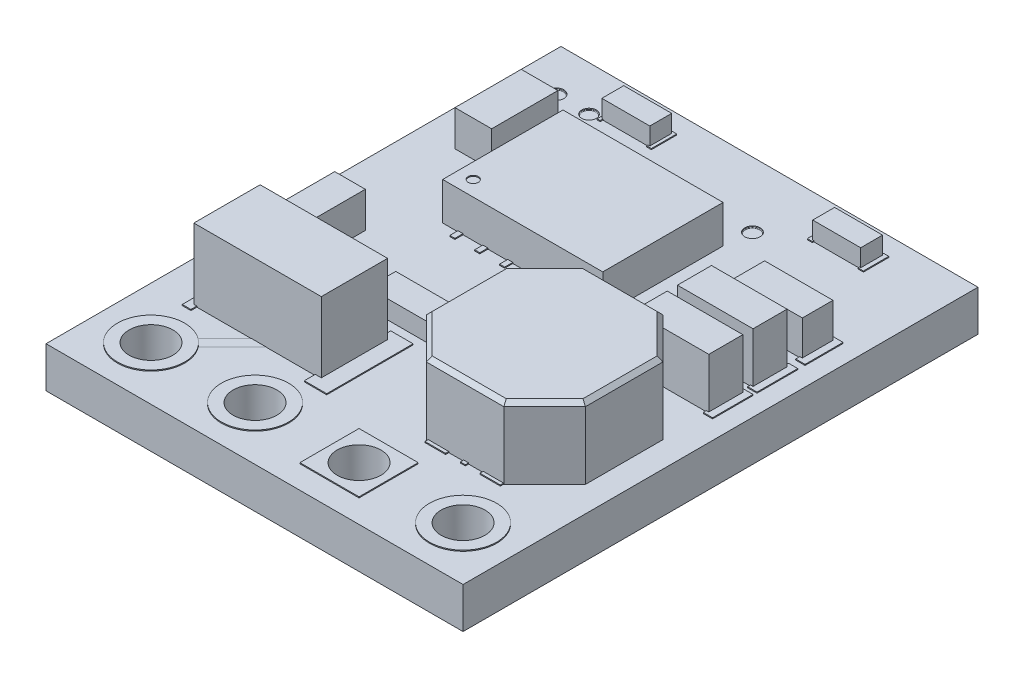
from build123d import *

# Parameters (mm, degrees)
SKETCH1_W            = 10.3886
SKETCH1_H            = 12.827
SKETCH1_R            = 0.5461
BOSS_EXTRUDE1_DEPTH  = 1.016
BOSS_EXTRUDE2_DEPTH  = 1.778
SKETCH3_W            = 3.9878
SKETCH3_H            = 2.9972
BOSS_EXTRUDE3_DEPTH  = 0.9398
SKETCH9_R            = 0.127
CUT_EXTRUDE1_DEPTH   = 0.0254
SKETCH10_W           = 0.127
SKETCH10_H           = 0.2032
BOSS_EXTRUDE9_DEPTH  = 0.0254
SKETCH4_W            = 1.882226921
SKETCH4_H            = 0.847687816
SKETCH4_H_2          = 0.847687817
BOSS_EXTRUDE4_DEPTH  = 1.27
SKETCH5_W            = 0.762
SKETCH5_H            = 1.7018
SKETCH5_W_2          = 0.9144
SKETCH5_H_2          = 1.651
SKETCH5_W_3          = 1.7018
SKETCH5_H_3          = 0.762
BOSS_EXTRUDE5_DEPTH  = 0.889
SKETCH6_W            = 1.194700402
SKETCH6_H            = 0.545311468
SKETCH6_W_2          = 1.556607048
SKETCH6_H_2          = 0.691125922
BOSS_EXTRUDE6_DEPTH  = 0.4572
SKETCH7_W            = 3.175
SKETCH7_H            = 1.651
BOSS_EXTRUDE7_DEPTH  = 1.778
SKETCH8_R            = 0.8382
SKETCH8_R_2          = 0.5461
SKETCH8_W            = 1.473254738
SKETCH8_H            = 1.473254738
SKETCH8_W_2          = 0.514455014
SKETCH8_H_2          = 0.351777281
SKETCH8_W_3          = 0.507888552
SKETCH8_W_4          = 0.124694155
SKETCH8_W_5          = 0.558345182
SKETCH8_H_3          = 2.151828792
SKETCH8_W_6          = 0.23200027
SKETCH8_H_4          = 1.006866904
SKETCH8_H_5          = 1.014783103
SKETCH8_H_6          = 0.947918641
SKETCH8_W_7          = 0.141780848
SKETCH8_H_7          = 0.876158761
SKETCH8_W_8          = 0.169982638
SKETCH8_W_9          = 0.132435414
SKETCH8_H_8          = 0.631181548
SKETCH8_W_10         = 0.12769563
SKETCH8_W_11         = 0.118360118
SKETCH8_W_12         = 0.074961408
SKETCH8_H_9          = 0.664291367
SKETCH8_W_13         = 0.215703518
SKETCH8_H_10         = 1.972146453
BOSS_EXTRUDE8_DEPTH  = 0.0254
CHAMFER1_SIZE        = 0.1016
BOSS_EXTRUDE10_START = 0.00254
SKETCH11_R           = 0.8382
SKETCH11_R_2         = 0.5461
SKETCH11_W           = 1.473254738
SKETCH11_H           = 1.473254738
BOSS_EXTRUDE10_DEPTH = 0.00254
SKETCH12_W           = 2.54
SKETCH12_H           = 3.568866899
SKETCH12_W_2         = 0.091179487
SKETCH12_H_2         = 1.042051282
SKETCH12_W_3         = 1.016
SKETCH12_H_3         = 0.091179487
BOSS_EXTRUDE11_DEPTH = 0.00254
SKETCH13_R           = 0.1887982
SKETCH13_R_2         = 0.1842516
SKETCH13_R_3         = 0.1929638
SKETCH13_R_4         = 0.186563
SKETCH13_R_5         = 0.1857248
SKETCH13_R_6         = 0.1898904
SKETCH13_R_7         = 0.1821942
CUT_EXTRUDE2_DEPTH   = 0.0381
CUT_EXTRUDE3_START   = -0.0381
SKETCH14_R           = 0.1821942
SKETCH14_R_2         = 0.1898904
SKETCH14_R_3         = 0.186563
SKETCH14_R_4         = 0.1929638
SKETCH14_R_5         = 0.1842516
SKETCH14_R_6         = 0.1887982
SKETCH14_R_7         = 0.1857248
CUT_EXTRUDE3_DEPTH   = 0.0381
FILLET1_R            = 0.01524
BOSS_EXTRUDE12_DEPTH = 0.00508


with BuildPart() as part:
    # Sketch1 → Boss-Extrude1 (new body)
    with BuildSketch(Plane(origin=(0, 0, 0), x_dir=(1, 0, 0), z_dir=(0, 1, 0))):
        Rectangle(SKETCH1_W, SKETCH1_H)
        with Locations((-3.8862, -5.1054)):
            Circle(SKETCH1_R, mode=Mode.SUBTRACT)
        with Locations((-1.2954, -5.1054)):
            Circle(SKETCH1_R, mode=Mode.SUBTRACT)
        with Locations((1.2954, -5.1054)):
            Circle(SKETCH1_R, mode=Mode.SUBTRACT)
        with Locations((3.8862, -5.1054)):
            Circle(SKETCH1_R, mode=Mode.SUBTRACT)
    extrude(amount=BOSS_EXTRUDE1_DEPTH)

    # Sketch2 → Boss-Extrude2 (add)
    with BuildSketch(Plane(origin=(0, 1.016, 0), x_dir=(1, 0, 0), z_dir=(0, 1, 0))):
        Polygon((3.5433, 0.2159), (4.5593, -0.8001), (4.5593, -2.7305), (3.5433, -3.7465), (1.6129, -3.7465), (0.5969, -2.7305), (0.5969, -0.8001), (1.6129, 0.2159), align=None)
    extrude(amount=BOSS_EXTRUDE2_DEPTH)

    # Sketch3 → Boss-Extrude3 (add)
    with BuildSketch(Plane(origin=(0, 1.016, 0), x_dir=(1, 0, 0), z_dir=(0, 1, 0))):
        with Locations((-0.8636, 2.6289)):
            Rectangle(SKETCH3_W, SKETCH3_H)
    extrude(amount=BOSS_EXTRUDE3_DEPTH)

    # Sketch9 → Cut-Extrude1 (cut)
    with BuildSketch(Plane(origin=(0, 1.9558, 0), x_dir=(1, 0, 0), z_dir=(0, 1, 0))):
        with Locations((-2.4765, 1.5113)):
            Circle(SKETCH9_R)
    extrude(amount=-CUT_EXTRUDE1_DEPTH, mode=Mode.SUBTRACT)

    # Sketch10 → Boss-Extrude9 (add)
    with BuildSketch(Plane(origin=(0, 1.016, 0), x_dir=(1, 0, 0), z_dir=(0, 1, 0))):
        with Locations((-2.413, 4.2291)):
            Rectangle(SKETCH10_W, SKETCH10_H)
        with Locations((-1.79324, 4.2291)):
            Rectangle(SKETCH10_W, SKETCH10_H)
        with Locations((-1.17348, 4.2291)):
            Rectangle(SKETCH10_W, SKETCH10_H)
        with Locations((-0.55372, 4.2291)):
            Rectangle(SKETCH10_W, SKETCH10_H)
        with Locations((0.06604, 4.2291)):
            Rectangle(SKETCH10_W, SKETCH10_H)
        with Locations((0.6858, 4.2291)):
            Rectangle(SKETCH10_W, SKETCH10_H)
        with Locations((0.6858, 1.0287)):
            Rectangle(SKETCH10_W, SKETCH10_H)
        with Locations((0.06604, 1.0287)):
            Rectangle(SKETCH10_W, SKETCH10_H)
        with Locations((-0.55372, 1.0287)):
            Rectangle(SKETCH10_W, SKETCH10_H)
        with Locations((-1.17348, 1.0287)):
            Rectangle(SKETCH10_W, SKETCH10_H)
        with Locations((-1.79324, 1.0287)):
            Rectangle(SKETCH10_W, SKETCH10_H)
        with Locations((-2.413, 1.0287)):
            Rectangle(SKETCH10_W, SKETCH10_H)
    extrude(amount=BOSS_EXTRUDE9_DEPTH)

    # Sketch4 → Boss-Extrude4 (add)
    with BuildSketch(Plane(origin=(0, 1.016, 0), x_dir=(1, 0, 0), z_dir=(0, 1, 0))):
        with Locations((3.61818654, 0.766743908)):
            Rectangle(SKETCH4_W, SKETCH4_H)
        with Locations((3.61818654, 1.868431725)):
            Rectangle(SKETCH4_W, SKETCH4_H_2)
    extrude(amount=BOSS_EXTRUDE4_DEPTH)

    # Sketch5 → Boss-Extrude5 (add)
    with BuildSketch(Plane(origin=(0, 1.016, 0), x_dir=(1, 0, 0), z_dir=(0, 1, 0))):
        with Locations((-4.041175586, -0.844701663)):
            Rectangle(SKETCH5_W, SKETCH5_H)
        with Locations((-3.848634085, 3.70974121)):
            Rectangle(SKETCH5_W_2, SKETCH5_H_2)
        with Locations((3.7084, 3.054275633)):
            Rectangle(SKETCH5_W_3, SKETCH5_H_3)
    extrude(amount=BOSS_EXTRUDE5_DEPTH)

    # Sketch6 → Boss-Extrude6 (add)
    with BuildSketch(Plane(origin=(0, 1.016, 0), x_dir=(1, 0, 0), z_dir=(0, 1, 0))):
        with Locations((-2.510902792, 5.618840725)):
            Rectangle(SKETCH6_W, SKETCH6_H)
        with Locations((2.741759329, 5.618840725)):
            Rectangle(SKETCH6_W, SKETCH6_H)
        with Locations((-1.162859389, -1.30009398)):
            Rectangle(SKETCH6_W_2, SKETCH6_H_2)
    extrude(amount=BOSS_EXTRUDE6_DEPTH)

    # Sketch7 → Boss-Extrude7 (add)
    with BuildSketch(Plane(origin=(0, 1.016, 0), x_dir=(1, 0, 0), z_dir=(0, 1, 0))):
        with Locations((-2.5908, -2.921)):
            Rectangle(SKETCH7_W, SKETCH7_H)
    extrude(amount=BOSS_EXTRUDE7_DEPTH)

    # Sketch8 → Boss-Extrude8 (add)
    # profile 1 of 19: a face of its own
    with BuildSketch(Plane(origin=(0, 1.016, 0), x_dir=(1, 0, 0), z_dir=(0, 1, 0))):
        with Locations((-3.8862, -5.1054)):
            Circle(SKETCH8_R)
        with Locations((-3.8862, -5.1054)):
            Circle(SKETCH8_R_2, mode=Mode.SUBTRACT)
    # profile 2 of 19: a face of its own
    with BuildSketch(Plane(origin=(0, 1.016, 0), x_dir=(1, 0, 0), z_dir=(0, 1, 0))):
        with Locations((-1.2954, -5.1054)):
            Circle(SKETCH8_R)
        with Locations((-1.2954, -5.1054)):
            Circle(SKETCH8_R_2, mode=Mode.SUBTRACT)
    # profile 3 of 19: a face of its own
    with BuildSketch(Plane(origin=(0, 1.016, 0), x_dir=(1, 0, 0), z_dir=(0, 1, 0))):
        with Locations((3.8862, -5.1054)):
            Circle(SKETCH8_R)
        with Locations((3.8862, -5.1054)):
            Circle(SKETCH8_R_2, mode=Mode.SUBTRACT)
    # profile 4 of 19: a face of its own
    with BuildSketch(Plane(origin=(0, 1.016, 0), x_dir=(1, 0, 0), z_dir=(0, 1, 0))):
        with Locations((1.2954, -5.1054)):
            Rectangle(SKETCH8_W, SKETCH8_H)
        with Locations((1.2954, -5.1054)):
            Circle(SKETCH8_R_2, mode=Mode.SUBTRACT)
    # profile 5 of 19: a face of its own
    with BuildSketch(Plane(origin=(0, 1.016, 0), x_dir=(1, 0, 0), z_dir=(0, 1, 0))):
        with Locations((1.915195492, -3.651602003)):
            Rectangle(SKETCH8_W_2, SKETCH8_H_2)
    # profile 6 of 19: a face of its own
    with BuildSketch(Plane(origin=(0, 1.016, 0), x_dir=(1, 0, 0), z_dir=(0, 1, 0))):
        with Locations((3.282503601, -3.651602003)):
            Rectangle(SKETCH8_W_3, SKETCH8_H_2)
    # profile 7 of 19: a face of its own
    with BuildSketch(Plane(origin=(0, 1.016, 0), x_dir=(1, 0, 0), z_dir=(0, 1, 0))):
        with Locations((2.603732876, -3.651602003)):
            Rectangle(SKETCH8_W_4, SKETCH8_H_2)
    # profile 8 of 19: a face of its own
    with BuildSketch(Plane(origin=(0, 1.016, 0), x_dir=(1, 0, 0), z_dir=(0, 1, 0))):
        with Locations((-0.874178944, -2.944091235)):
            Rectangle(SKETCH8_W_5, SKETCH8_H_3)
    # profile 9 of 19: a face of its own
    with BuildSketch(Plane(origin=(0, 1.016, 0), x_dir=(1, 0, 0), z_dir=(0, 1, 0))):
        with Locations((4.613692111, 0.769830085)):
            Rectangle(SKETCH8_W_6, SKETCH8_H_4)
    # profile 10 of 19: a face of its own
    with BuildSketch(Plane(origin=(0, 1.016, 0), x_dir=(1, 0, 0), z_dir=(0, 1, 0))):
        with Locations((4.613692111, 1.880888202)):
            Rectangle(SKETCH8_W_6, SKETCH8_H_5)
    # profile 11 of 19: a face of its own
    with BuildSketch(Plane(origin=(0, 1.016, 0), x_dir=(1, 0, 0), z_dir=(0, 1, 0))):
        with Locations((4.613692111, 3.044073717)):
            Rectangle(SKETCH8_W_6, SKETCH8_H_6)
    # profile 12 of 19: a face of its own
    with BuildSketch(Plane(origin=(0, 1.016, 0), x_dir=(1, 0, 0), z_dir=(0, 1, 0))):
        with Locations((2.829519142, 3.079953657)):
            Rectangle(SKETCH8_W_7, SKETCH8_H_7)
    # profile 13 of 19: a face of its own
    with BuildSketch(Plane(origin=(0, 1.016, 0), x_dir=(1, 0, 0), z_dir=(0, 1, 0))):
        with Locations((2.626377117, 1.880888202)):
            Rectangle(SKETCH8_W_8, SKETCH8_H_5)
    # profile 14 of 19: a face of its own
    with BuildSketch(Plane(origin=(0, 1.016, 0), x_dir=(1, 0, 0), z_dir=(0, 1, 0))):
        with Locations((2.626377117, 0.769830085)):
            Rectangle(SKETCH8_W_8, SKETCH8_H_4)
    # profile 15 of 19: a face of its own
    with BuildSketch(Plane(origin=(0, 1.016, 0), x_dir=(1, 0, 0), z_dir=(0, 1, 0))):
        with Locations((3.376087059, 5.626877243)):
            Rectangle(SKETCH8_W_9, SKETCH8_H_8)
    # profile 16 of 19: a face of its own
    with BuildSketch(Plane(origin=(0, 1.016, 0), x_dir=(1, 0, 0), z_dir=(0, 1, 0))):
        with Locations((2.108575184, 5.626877243)):
            Rectangle(SKETCH8_W_10, SKETCH8_H_8)
    # profile 17 of 19: a face of its own
    with BuildSketch(Plane(origin=(0, 1.016, 0), x_dir=(1, 0, 0), z_dir=(0, 1, 0))):
        with Locations((-1.898575267, 5.626877243)):
            Rectangle(SKETCH8_W_11, SKETCH8_H_8)
    # profile 18 of 19: a face of its own
    with BuildSketch(Plane(origin=(0, 1.016, 0), x_dir=(1, 0, 0), z_dir=(0, 1, 0))):
        with Locations((-3.119657157, 5.610322334)):
            Rectangle(SKETCH8_W_12, SKETCH8_H_9)
    # profile 19 of 19: a face of its own
    with BuildSketch(Plane(origin=(0, 1.016, 0), x_dir=(1, 0, 0), z_dir=(0, 1, 0))):
        with Locations((-4.211467893, -2.908689507)):
            Rectangle(SKETCH8_W_13, SKETCH8_H_10)
    extrude(amount=BOSS_EXTRUDE8_DEPTH)

    # Chamfer1
    chamfer1_edges = [part.edges().sort_by_distance(p)[0] for p in [
        (1.1049, 2.794, 0.2921),
        (2.5781, 2.794, -0.2159),
        (4.0513, 2.794, 0.2921),
        (4.5593, 2.794, 1.7653),
        (4.0513, 2.794, 3.2385),
        (0.5969, 2.794, 1.7653),
        (1.1049, 2.794, 3.2385),
        (2.5781, 2.794, 3.7465),
    ]]
    chamfer(chamfer1_edges, length=CHAMFER1_SIZE)

    # Sketch11 → Boss-Extrude10 (add)
    # profile 1 of 4: a face of its own
    with BuildSketch(Plane.XZ.offset(BOSS_EXTRUDE10_START)):
        with Locations((-3.8862, 5.1054)):
            Circle(SKETCH11_R)
        with Locations((-3.8862, 5.1054)):
            Circle(SKETCH11_R_2, mode=Mode.SUBTRACT)
    # profile 2 of 4: a face of its own
    with BuildSketch(Plane.XZ.offset(BOSS_EXTRUDE10_START)):
        with Locations((-1.2954, 5.1054)):
            Circle(SKETCH11_R)
        with Locations((-1.2954, 5.1054)):
            Circle(SKETCH11_R_2, mode=Mode.SUBTRACT)
    # profile 3 of 4: a face of its own
    with BuildSketch(Plane.XZ.offset(BOSS_EXTRUDE10_START)):
        with Locations((3.8862, 5.1054)):
            Circle(SKETCH11_R)
        with Locations((3.8862, 5.1054)):
            Circle(SKETCH11_R_2, mode=Mode.SUBTRACT)
    # profile 4 of 4: a face of its own
    with BuildSketch(Plane.XZ.offset(BOSS_EXTRUDE10_START)):
        with Locations((1.2954, 5.1054)):
            Rectangle(SKETCH11_W, SKETCH11_H)
        with Locations((1.2954, 5.1054)):
            Circle(SKETCH11_R_2, mode=Mode.SUBTRACT)
    extrude(amount=-BOSS_EXTRUDE10_DEPTH)

    # Sketch12 → Boss-Extrude11 (add)
    # profile 1 of 33: a face of its own
    with BuildSketch(Plane.XZ):
        with Locations((-3.2893, -4.051392271)):
            Rectangle(SKETCH12_W, SKETCH12_H)
    # profile 2 of 33: a face of its own
    with BuildSketch(Plane.XZ):
        with BuildLine():
            Line((1.979084744, -2.180056018), (1.779833142, -2.180056018))
            add(Edge.make_bspline(
                [(1.779833142, -2.180056018), (1.76612849, -2.180040953), (1.739869769, -2.180012088), (1.702215341, -2.179136951), (1.668016859, -2.17796806), (1.637348063, -2.176347716), (1.61011459, -2.17443282), (1.586439671, -2.171747085), (1.566137217, -2.168942839), (1.553972373, -2.166091825), (1.548424488, -2.164791595)],
                knots=[0, 0, 0, 0, 1.415646017, 2.712440637, 3.8905458, 4.950247383, 5.884950622, 6.709939814, 7.411656543, 8, 8, 8, 8], degree=3))
            add(Edge.make_bspline(
                [(1.548424488, -2.164791595), (1.541401495, -2.162869279), (1.527520998, -2.159069945), (1.507519364, -2.151461315), (1.488492416, -2.142435491), (1.470360566, -2.132163944), (1.453434432, -2.120161604), (1.43718555, -2.107121203), (1.42195468, -2.092515359), (1.407971805, -2.0763633), (1.395016068, -2.059194162), (1.384171187, -2.04057014), (1.374594731, -2.021137311), (1.367131711, -2.000421215), (1.361265491, -1.978695302), (1.356993116, -1.955903026), (1.35424717, -1.932093555), (1.353986614, -1.915819617), (1.353853975, -1.907535184)],
                knots=[0, 0, 0, 0, 0.999333726, 1.975119402, 2.933498163, 3.889020618, 4.832249799, 5.779334906, 6.747801194, 7.724875447, 8.710438469, 9.696133548, 10.679360639, 11.681339199, 12.714023775, 13.766351759, 14.862936069, 16, 16, 16, 16], degree=3))
            add(Edge.make_bspline(
                [(1.353853975, -1.907535184), (1.353976309, -1.899181407), (1.354215662, -1.882836677), (1.357088413, -1.858925033), (1.360957977, -1.836074209), (1.366907978, -1.814334872), (1.374700894, -1.793836122), (1.383842587, -1.774264702), (1.394868663, -1.755953574), (1.407538134, -1.738836262), (1.421631968, -1.722896699), (1.437090535, -1.708250393), (1.453851427, -1.694983077), (1.471861376, -1.683065007), (1.491295961, -1.672772555), (1.511860426, -1.663553863), (1.533733517, -1.655811635), (1.548869744, -1.651738909), (1.556565513, -1.649668197)],
                knots=[0, 0, 0, 0, 1.121902311, 2.195077645, 3.232258892, 4.234102512, 5.217864754, 6.176164875, 7.132989551, 8.084763148, 9.034132444, 9.988522005, 10.94243251, 11.903244335, 12.886203696, 13.894208494, 14.929344452, 16, 16, 16, 16], degree=3))
            add(Edge.make_bspline(
                [(1.556565513, -1.649668197), (1.562930778, -1.648315609), (1.576880625, -1.645351334), (1.599853186, -1.642019572), (1.626613645, -1.639287162), (1.657070952, -1.636737256), (1.691296132, -1.635386125), (1.729210689, -1.633799676), (1.770942939, -1.633051118), (1.800049882, -1.6330038), (1.815246603, -1.632979095)],
                knots=[0, 0, 0, 0, 0.601372724, 1.317943291, 2.144091499, 3.08771165, 4.142394186, 5.309582461, 6.595334295, 8, 8, 8, 8], degree=3))
            Line((1.815246603, -1.632979095), (1.887905257, -1.632979095))
            Line((1.887905257, -1.632979095), (1.887905257, -1.164056018))
            Line((1.887905257, -1.164056018), (1.979084744, -1.164056018))
            Line((1.979084744, -1.164056018), (1.979084744, -2.180056018))
        make_face()
        with BuildLine():
            Line((1.887905257, -2.07585089), (1.887905257, -1.737184223))
            Line((1.887905257, -1.737184223), (1.710023847, -1.734945441))
            add(Edge.make_bspline(
                [(1.710023847, -1.734945441), (1.701338374, -1.734939714), (1.684571247, -1.734928658), (1.660285218, -1.736105349), (1.637807632, -1.737385456), (1.6171053, -1.739455693), (1.598272713, -1.741980736), (1.581264276, -1.745356732), (1.565944253, -1.74880003), (1.548297282, -1.754774763), (1.528530825, -1.763788405), (1.507077219, -1.777251404), (1.488746871, -1.794211397), (1.473018553, -1.813486606), (1.460586391, -1.834952051), (1.451576265, -1.85785506), (1.446076671, -1.882108668), (1.445385418, -1.898687101), (1.445033462, -1.907128133)],
                knots=[0, 0, 0, 0, 1.160501667, 2.240324542, 3.248665471, 4.168823117, 5.020172044, 5.786515869, 6.485785279, 7.116517804, 8.272762037, 9.381837012, 10.485674779, 11.594342068, 12.695271952, 13.786226926, 14.872841088, 16, 16, 16, 16], degree=3))
            add(Edge.make_bspline(
                [(1.445033462, -1.907128133), (1.445401121, -1.915295699), (1.44613198, -1.931531809), (1.451530836, -1.955338555), (1.460681811, -1.977981193), (1.473028688, -1.999276504), (1.488380101, -2.018500481), (1.506345895, -2.035082499), (1.526646552, -2.0485037), (1.545383215, -2.057438066), (1.562151052, -2.062677377), (1.576645322, -2.066459894), (1.593094102, -2.069068616), (1.611341724, -2.071564672), (1.631364825, -2.073579532), (1.653290728, -2.074978716), (1.677046399, -2.075788995), (1.693537619, -2.075829759), (1.702086347, -2.07585089)],
                knots=[0, 0, 0, 0, 1.12039168, 2.227199994, 3.330242575, 4.460839274, 5.593542475, 6.693949254, 7.801736126, 8.92216649, 9.528704869, 10.210659466, 10.975987387, 11.81211542, 12.738540127, 13.736887663, 14.826846554, 16, 16, 16, 16], degree=3))
            Line((1.702086347, -2.07585089), (1.887905257, -2.07585089))
        make_face(mode=Mode.SUBTRACT)
    # profile 3 of 33: a face of its own
    with BuildSketch(Plane.XZ):
        with BuildLine():
            add(Edge.make_bspline(
                [(0.812882821, -1.919543197), (0.798951294, -1.919247427), (0.771634975, -1.918667495), (0.731636212, -1.912438709), (0.69349449, -1.902993153), (0.657046193, -1.889697304), (0.622592822, -1.872252631), (0.589826765, -1.85115683), (0.55881367, -1.826267177), (0.540229474, -1.807002756), (0.530796283, -1.797224287)],
                knots=[0, 0, 0, 0, 1.054042676, 2.066720093, 3.05716247, 4.025731183, 4.997454851, 5.974904663, 6.97207755, 8, 8, 8, 8], degree=3))
            add(Edge.make_bspline(
                [(0.530796283, -1.797224287), (0.522673521, -1.787873027), (0.506585196, -1.76935148), (0.485955833, -1.739319794), (0.468184089, -1.708218553), (0.453941812, -1.675634758), (0.442712102, -1.641852853), (0.434739203, -1.606756726), (0.429996824, -1.570423885), (0.429357334, -1.545748485), (0.429033462, -1.533251531)],
                knots=[0, 0, 0, 0, 1.025258237, 2.030674902, 3.01204498, 3.988269485, 4.97094183, 5.956517959, 6.965070386, 8, 8, 8, 8], degree=3))
            add(Edge.make_bspline(
                [(0.429033462, -1.533251531), (0.42931833, -1.520682142), (0.429881243, -1.495844445), (0.435206133, -1.459262824), (0.443488299, -1.423791411), (0.4553412, -1.38957872), (0.470540005, -1.356520148), (0.489086584, -1.324760174), (0.511110933, -1.294235797), (0.536077042, -1.265207525), (0.563667837, -1.238449883), (0.593606076, -1.215142984), (0.625325126, -1.195091058), (0.659257982, -1.179164253), (0.694921621, -1.166326139), (0.732542887, -1.157473433), (0.772088219, -1.152073042), (0.799093341, -1.151382821), (0.812882821, -1.151030377)],
                knots=[0, 0, 0, 0, 0.998669827, 1.973418153, 2.932281609, 3.89081133, 4.846438734, 5.82045571, 6.809776312, 7.834649874, 8.860672198, 9.859676908, 10.845817165, 11.837296335, 12.833502054, 13.853824644, 14.904110009, 16, 16, 16, 16], degree=3))
            add(Edge.make_bspline(
                [(0.812882821, -1.151030377), (0.826739199, -1.151385737), (0.853877614, -1.152081728), (0.89357185, -1.157433262), (0.931351513, -1.166420726), (0.96718385, -1.17900532), (1.001116569, -1.195221876), (1.032952741, -1.215064964), (1.062905102, -1.238461685), (1.090504547, -1.265204327), (1.115468336, -1.294236621), (1.137493284, -1.324759961), (1.156039708, -1.356520203), (1.171238553, -1.389578705), (1.183091443, -1.423791415), (1.191373612, -1.459262823), (1.196698501, -1.495844445), (1.197261414, -1.520682143), (1.197546283, -1.533251531)],
                knots=[0, 0, 0, 0, 1.099861214, 2.154133753, 3.1731438, 4.178222029, 5.163564916, 6.153006591, 7.15072618, 8.175428628, 9.198983792, 10.187031731, 11.15979573, 12.114193814, 13.071490482, 14.029120454, 15.002614863, 16, 16, 16, 16], degree=3))
            add(Edge.make_bspline(
                [(1.197546283, -1.533251531), (1.197220976, -1.54568084), (1.196576926, -1.570288735), (1.191828075, -1.606549252), (1.183941927, -1.641537965), (1.172556542, -1.675135393), (1.158340703, -1.707640874), (1.140747824, -1.738856148), (1.119918906, -1.768756609), (1.103893084, -1.787253594), (1.095783462, -1.79661371)],
                knots=[0, 0, 0, 0, 1.031377469, 2.041950136, 3.029500481, 4.003457997, 4.981637986, 5.969878303, 6.97268806, 8, 8, 8, 8], degree=3))
            add(Edge.make_bspline(
                [(1.095783462, -1.79661371), (1.086363712, -1.806475333), (1.067838115, -1.825869949), (1.036681859, -1.850710494), (1.00405675, -1.872090717), (0.969381143, -1.889526611), (0.932831499, -1.902969029), (0.8944063, -1.912482794), (0.854261949, -1.918639943), (0.826813324, -1.919239112), (0.812882821, -1.919543197)],
                knots=[0, 0, 0, 0, 1.027951202, 2.021646915, 2.998468564, 3.9668038, 4.943370589, 5.93035926, 6.949632805, 8, 8, 8, 8], degree=3))
        make_face()
        with BuildLine():
            add(Edge.make_bspline(
                [(0.813289872, -1.82836371), (0.823141465, -1.828083688), (0.842590333, -1.827530872), (0.871218349, -1.82332662), (0.89877753, -1.81666448), (0.925323673, -1.807202964), (0.950754131, -1.79497102), (0.975096792, -1.780031803), (0.998286611, -1.762305907), (1.020144064, -1.742145029), (1.040443334, -1.720248682), (1.057969004, -1.696696537), (1.072983114, -1.672143039), (1.085250869, -1.64644941), (1.094662618, -1.61954506), (1.101331139, -1.591583923), (1.10554337, -1.562482779), (1.106089347, -1.542695994), (1.106366795, -1.532640954)],
                knots=[0, 0, 0, 0, 1.021608339, 2.016844023, 2.99486249, 3.958675159, 4.934437641, 5.916902129, 6.916234728, 7.957219854, 8.998204981, 10.008773588, 10.997243553, 11.979355116, 12.956436335, 13.948132639, 14.957303585, 16, 16, 16, 16], degree=3))
            add(Edge.make_bspline(
                [(1.106366795, -1.532640954), (1.105901588, -1.519649505), (1.104978239, -1.49386391), (1.097431511, -1.455899752), (1.084896045, -1.419384574), (1.067610476, -1.384758031), (1.046322778, -1.35266476), (1.021431181, -1.323806339), (0.992591551, -1.299295665), (0.960785931, -1.278681775), (0.926465048, -1.262448357), (0.890204307, -1.250806837), (0.852333871, -1.243341031), (0.826418441, -1.24259022), (0.813289872, -1.242209864)],
                knots=[0, 0, 0, 0, 1.016977094, 2.018509362, 3.018404954, 4.033172147, 5.041280572, 6.028085189, 7.007940189, 7.995502847, 8.989109012, 9.972200833, 10.97273166, 12, 12, 12, 12], degree=3))
            add(Edge.make_bspline(
                [(0.813289872, -1.242209864), (0.800160548, -1.242588016), (0.774243628, -1.243334479), (0.7363205, -1.250844661), (0.69996038, -1.262397735), (0.665603812, -1.27870011), (0.633783708, -1.29921775), (0.605150012, -1.323945974), (0.580044052, -1.352588896), (0.558735276, -1.384715478), (0.541728225, -1.419438406), (0.529133808, -1.455893023), (0.521605179, -1.493865624), (0.520679387, -1.51965008), (0.520212949, -1.532640954)],
                knots=[0, 0, 0, 0, 1.027082318, 2.027431966, 3.015401697, 4.008827937, 4.996211763, 5.971861488, 6.96198607, 7.969911943, 8.982141629, 9.981856156, 10.983207064, 12, 12, 12, 12], degree=3))
            add(Edge.make_bspline(
                [(0.520212949, -1.532640954), (0.520488319, -1.542696803), (0.521030206, -1.562485178), (0.525272187, -1.591574753), (0.531836036, -1.619600747), (0.54165357, -1.646340902), (0.553493918, -1.672268117), (0.568872027, -1.696623002), (0.586316111, -1.720263622), (0.606652592, -1.742131838), (0.628507592, -1.762379567), (0.651871622, -1.779967231), (0.676225589, -1.794979551), (0.701664084, -1.807204471), (0.728150154, -1.816628062), (0.755625664, -1.823355641), (0.784126901, -1.827515543), (0.803506708, -1.828079179), (0.813289872, -1.82836371)],
                knots=[0, 0, 0, 0, 1.043037354, 2.052538279, 3.044558847, 4.0243144, 5.003741121, 5.996211188, 7.007110229, 8.048435736, 9.089761243, 10.095031504, 11.077817236, 12.053898772, 13.018026588, 13.989527945, 14.985089051, 16, 16, 16, 16], degree=3))
        make_face(mode=Mode.SUBTRACT)
    # profile 4 of 33: a face of its own
    with BuildSketch(Plane.XZ):
        with Locations((0.214110386, -1.685081659)):
            Rectangle(SKETCH12_W_2, SKETCH12_H_2)
    # profile 5 of 33: a face of its own
    with BuildSketch(Plane.XZ):
        with BuildLine():
            add(Edge.make_bspline(
                [(-0.398501794, -1.919543197), (-0.412433321, -1.919247427), (-0.43974964, -1.918667495), (-0.479748404, -1.912438709), (-0.517890126, -1.902993153), (-0.554338423, -1.889697304), (-0.588791794, -1.872252631), (-0.621557851, -1.85115683), (-0.652570946, -1.826267177), (-0.671155141, -1.807002756), (-0.680588333, -1.797224287)],
                knots=[0, 0, 0, 0, 1.054042676, 2.066720093, 3.05716247, 4.025731183, 4.997454851, 5.974904663, 6.97207755, 8, 8, 8, 8], degree=3))
            add(Edge.make_bspline(
                [(-0.680588333, -1.797224287), (-0.688711094, -1.787873027), (-0.704799419, -1.76935148), (-0.725428782, -1.739319794), (-0.743200527, -1.708218553), (-0.757442803, -1.675634758), (-0.768672513, -1.641852853), (-0.776645412, -1.606756726), (-0.781387791, -1.570423885), (-0.782027281, -1.545748485), (-0.782351153, -1.533251531)],
                knots=[0, 0, 0, 0, 1.025258237, 2.030674902, 3.01204498, 3.988269485, 4.97094183, 5.956517959, 6.965070386, 8, 8, 8, 8], degree=3))
            add(Edge.make_bspline(
                [(-0.782351153, -1.533251531), (-0.782066285, -1.520682142), (-0.781503372, -1.495844445), (-0.776178482, -1.459262824), (-0.767896316, -1.423791411), (-0.756043415, -1.38957872), (-0.740844611, -1.356520148), (-0.722298031, -1.324760174), (-0.700273682, -1.294235797), (-0.675307573, -1.265207525), (-0.647716778, -1.238449883), (-0.617778539, -1.215142984), (-0.58605949, -1.195091058), (-0.552126634, -1.179164253), (-0.516462994, -1.166326139), (-0.478841728, -1.157473433), (-0.439296397, -1.152073042), (-0.412291275, -1.151382821), (-0.398501794, -1.151030377)],
                knots=[0, 0, 0, 0, 0.998669827, 1.973418153, 2.932281609, 3.89081133, 4.846438734, 5.82045571, 6.809776312, 7.834649874, 8.860672198, 9.859676908, 10.845817165, 11.837296335, 12.833502054, 13.853824644, 14.904110009, 16, 16, 16, 16], degree=3))
            add(Edge.make_bspline(
                [(-0.398501794, -1.151030377), (-0.384645417, -1.151385737), (-0.357507001, -1.152081728), (-0.317812765, -1.157433262), (-0.280033102, -1.166420726), (-0.244200765, -1.17900532), (-0.210268047, -1.195221876), (-0.178431874, -1.215064964), (-0.148479514, -1.238461685), (-0.120880068, -1.265204327), (-0.095916279, -1.294236621), (-0.073891331, -1.324759961), (-0.055344908, -1.356520203), (-0.040146062, -1.389578705), (-0.028293172, -1.423791415), (-0.020011003, -1.459262823), (-0.014686114, -1.495844445), (-0.014123201, -1.520682143), (-0.013838333, -1.533251531)],
                knots=[0, 0, 0, 0, 1.099861214, 2.154133753, 3.1731438, 4.178222029, 5.163564916, 6.153006591, 7.15072618, 8.175428628, 9.198983792, 10.187031731, 11.15979573, 12.114193814, 13.071490482, 14.029120454, 15.002614863, 16, 16, 16, 16], degree=3))
            add(Edge.make_bspline(
                [(-0.013838333, -1.533251531), (-0.014163639, -1.54568084), (-0.014807689, -1.570288735), (-0.01955654, -1.606549252), (-0.027442688, -1.641537965), (-0.038828074, -1.675135393), (-0.053043912, -1.707640874), (-0.070636792, -1.738856148), (-0.091465709, -1.768756609), (-0.107491532, -1.787253594), (-0.115601153, -1.79661371)],
                knots=[0, 0, 0, 0, 1.031377469, 2.041950136, 3.029500481, 4.003457997, 4.981637986, 5.969878303, 6.97268806, 8, 8, 8, 8], degree=3))
            add(Edge.make_bspline(
                [(-0.115601153, -1.79661371), (-0.125020904, -1.806475333), (-0.1435465, -1.825869949), (-0.174702756, -1.850710494), (-0.207327865, -1.872090717), (-0.242003472, -1.889526611), (-0.278553116, -1.902969029), (-0.316978315, -1.912482794), (-0.357122666, -1.918639943), (-0.384571292, -1.919239112), (-0.398501794, -1.919543197)],
                knots=[0, 0, 0, 0, 1.027951202, 2.021646915, 2.998468564, 3.9668038, 4.943370589, 5.93035926, 6.949632805, 8, 8, 8, 8], degree=3))
        make_face()
        with BuildLine():
            add(Edge.make_bspline(
                [(-0.398094743, -1.82836371), (-0.38824315, -1.828083688), (-0.368794282, -1.827530872), (-0.340166266, -1.82332662), (-0.312607085, -1.81666448), (-0.286060942, -1.807202964), (-0.260630484, -1.79497102), (-0.236287823, -1.780031803), (-0.213098005, -1.762305907), (-0.191240551, -1.742145029), (-0.170941281, -1.720248682), (-0.153415611, -1.696696537), (-0.138401501, -1.672143039), (-0.126133747, -1.64644941), (-0.116721997, -1.61954506), (-0.110053476, -1.591583923), (-0.105841245, -1.562482779), (-0.105295268, -1.542695994), (-0.10501782, -1.532640954)],
                knots=[0, 0, 0, 0, 1.021608339, 2.016844023, 2.99486249, 3.958675159, 4.934437641, 5.916902129, 6.916234728, 7.957219854, 8.998204981, 10.008773588, 10.997243553, 11.979355116, 12.956436335, 13.948132639, 14.957303585, 16, 16, 16, 16], degree=3))
            add(Edge.make_bspline(
                [(-0.10501782, -1.532640954), (-0.105483027, -1.519649505), (-0.106406376, -1.49386391), (-0.113953104, -1.455899752), (-0.126488571, -1.419384574), (-0.143774139, -1.384758031), (-0.165061837, -1.35266476), (-0.189953434, -1.323806339), (-0.218793065, -1.299295665), (-0.250598684, -1.278681775), (-0.284919567, -1.262448357), (-0.321180309, -1.250806837), (-0.359050744, -1.243341031), (-0.384966174, -1.24259022), (-0.398094743, -1.242209864)],
                knots=[0, 0, 0, 0, 1.016977094, 2.018509362, 3.018404954, 4.033172147, 5.041280572, 6.028085189, 7.007940189, 7.995502847, 8.989109012, 9.972200833, 10.97273166, 12, 12, 12, 12], degree=3))
            add(Edge.make_bspline(
                [(-0.398094743, -1.242209864), (-0.411224067, -1.242588016), (-0.437140988, -1.243334479), (-0.475064115, -1.250844661), (-0.511424236, -1.262397735), (-0.545780803, -1.27870011), (-0.577600907, -1.29921775), (-0.606234603, -1.323945974), (-0.631340563, -1.352588896), (-0.65264934, -1.384715478), (-0.66965639, -1.419438406), (-0.682250807, -1.455893023), (-0.689779436, -1.493865624), (-0.690705228, -1.51965008), (-0.691171666, -1.532640954)],
                knots=[0, 0, 0, 0, 1.027082318, 2.027431966, 3.015401697, 4.008827937, 4.996211763, 5.971861488, 6.96198607, 7.969911943, 8.982141629, 9.981856156, 10.983207064, 12, 12, 12, 12], degree=3))
            add(Edge.make_bspline(
                [(-0.691171666, -1.532640954), (-0.690896296, -1.542696803), (-0.69035441, -1.562485178), (-0.686112429, -1.591574753), (-0.679548579, -1.619600747), (-0.669731046, -1.646340902), (-0.657890697, -1.672268117), (-0.642512588, -1.696623002), (-0.625068505, -1.720263622), (-0.604732024, -1.742131838), (-0.582877024, -1.762379567), (-0.559512993, -1.779967231), (-0.535159026, -1.794979551), (-0.509720532, -1.807204471), (-0.483234461, -1.816628062), (-0.455758951, -1.823355641), (-0.427257714, -1.827515543), (-0.407877907, -1.828079179), (-0.398094743, -1.82836371)],
                knots=[0, 0, 0, 0, 1.043037354, 2.052538279, 3.044558847, 4.0243144, 5.003741121, 5.996211188, 7.007110229, 8.048435736, 9.089761243, 10.095031504, 11.077817236, 12.053898772, 13.018026588, 13.989527945, 14.985089051, 16, 16, 16, 16], degree=3))
        make_face(mode=Mode.SUBTRACT)
    # profile 6 of 33: a face of its own
    with BuildSketch(Plane.XZ):
        with Locations((-0.997274231, -1.685081659)):
            Rectangle(SKETCH12_W_2, SKETCH12_H_2)
    # profile 7 of 33: a face of its own
    with BuildSketch(Plane.XZ):
        with BuildLine():
            Line((-1.238248589, -1.906517556), (-1.329428076, -1.906517556))
            Line((-1.329428076, -1.906517556), (-1.329428076, -1.562152172))
            add(Edge.make_bspline(
                [(-1.329428076, -1.562152172), (-1.329469269, -1.552043625), (-1.329548069, -1.532706449), (-1.330082468, -1.504881057), (-1.331339433, -1.479505235), (-1.332910989, -1.456564321), (-1.334931997, -1.436062198), (-1.337336538, -1.418070477), (-1.340024126, -1.402385125), (-1.342654902, -1.392938254), (-1.343878397, -1.3885448)],
                knots=[0, 0, 0, 0, 1.388932606, 2.656963016, 3.823490214, 4.879454478, 5.816252168, 6.653371382, 7.373723809, 8, 8, 8, 8], degree=3))
            add(Edge.make_bspline(
                [(-1.343878397, -1.3885448), (-1.345841163, -1.383022748), (-1.349725891, -1.372093445), (-1.35677195, -1.35630487), (-1.365489443, -1.341682477), (-1.375025597, -1.327657407), (-1.386037023, -1.3146637), (-1.398362714, -1.302616488), (-1.411783891, -1.291375237), (-1.431443259, -1.277817389), (-1.458317858, -1.263469426), (-1.493522739, -1.250916752), (-1.531764259, -1.243525092), (-1.558226009, -1.242656376), (-1.571827115, -1.242209864)],
                knots=[0, 0, 0, 0, 0.725930277, 1.436768641, 2.137297926, 2.832005607, 3.535753883, 4.242956221, 4.964984144, 5.701683124, 7.198126434, 8.723945959, 10.316137162, 12, 12, 12, 12], degree=3))
            add(Edge.make_bspline(
                [(-1.571827115, -1.242209864), (-1.585429944, -1.242654708), (-1.611682212, -1.243513219), (-1.649524164, -1.250805152), (-1.684179958, -1.26270134), (-1.715244958, -1.279539948), (-1.742524149, -1.300068399), (-1.76525423, -1.324166444), (-1.78400894, -1.351060783), (-1.792197712, -1.371126634), (-1.796315897, -1.381217877)],
                knots=[0, 0, 0, 0, 1.157091467, 2.233085092, 3.266839029, 4.264239195, 5.228693433, 6.160074799, 7.074690074, 8, 8, 8, 8], degree=3))
            add(Edge.make_bspline(
                [(-1.796315897, -1.381217877), (-1.797534323, -1.385272008), (-1.800227964, -1.394234701), (-1.803101362, -1.409441566), (-1.805796901, -1.427558666), (-1.80759399, -1.448776264), (-1.80964502, -1.472907254), (-1.810353246, -1.500076428), (-1.81136463, -1.530123641), (-1.81137262, -1.551160521), (-1.811376794, -1.562152172)],
                knots=[0, 0, 0, 0, 0.557560243, 1.232629526, 2.036798082, 2.970922211, 4.03790722, 5.227863888, 6.551574656, 8, 8, 8, 8], degree=3))
            Line((-1.811376794, -1.562152172), (-1.811376794, -1.906517556))
            Line((-1.811376794, -1.906517556), (-1.902556281, -1.906517556))
            Line((-1.902556281, -1.906517556), (-1.902556281, -1.545056018))
            add(Edge.make_bspline(
                [(-1.902556281, -1.545056018), (-1.902427603, -1.532774919), (-1.90217795, -1.508947906), (-1.90058551, -1.474320504), (-1.897815155, -1.441987886), (-1.893718763, -1.412049026), (-1.888749275, -1.384496766), (-1.882465312, -1.359322437), (-1.874922098, -1.336491026), (-1.866410338, -1.315669407), (-1.85637966, -1.296772844), (-1.845638242, -1.278938219), (-1.833560568, -1.262224326), (-1.820388126, -1.246478253), (-1.80573966, -1.232082106), (-1.790380122, -1.218297761), (-1.77355947, -1.205975619), (-1.755844563, -1.194459283), (-1.736788799, -1.184239332), (-1.716556076, -1.175396294), (-1.6951678, -1.167713187), (-1.672590564, -1.161776076), (-1.648837607, -1.156767151), (-1.62393926, -1.15343329), (-1.597848139, -1.151304654), (-1.580108258, -1.151123338), (-1.571013012, -1.151030377)],
                knots=[0, 0, 0, 0, 1.493120159, 2.896857355, 4.213387119, 5.437035652, 6.569467867, 7.615715674, 8.588612823, 9.490833737, 10.346735778, 11.186995163, 12.020221603, 12.851363391, 13.679553205, 14.515225522, 15.358192885, 16.211587453, 17.082499898, 17.983626775, 18.894104459, 19.842498226, 20.819547185, 21.843713668, 22.894470975, 24, 24, 24, 24], degree=3))
            add(Edge.make_bspline(
                [(-1.571013012, -1.151030377), (-1.56198609, -1.151128851), (-1.544247349, -1.151322362), (-1.518217747, -1.153397479), (-1.493265655, -1.156818218), (-1.469493999, -1.161735925), (-1.446806967, -1.167761042), (-1.425314701, -1.175342276), (-1.404990062, -1.184289933), (-1.385789319, -1.194468832), (-1.367776175, -1.2059337), (-1.350991117, -1.21855207), (-1.33513491, -1.231994714), (-1.320647701, -1.246720092), (-1.307423234, -1.262617955), (-1.295404175, -1.279616864), (-1.284384952, -1.297524695), (-1.274413085, -1.316702186), (-1.26584617, -1.337768718), (-1.258282727, -1.361077844), (-1.252096546, -1.386884966), (-1.247062277, -1.415168066), (-1.243012373, -1.445791768), (-1.240200624, -1.478933229), (-1.238628486, -1.514511717), (-1.238377952, -1.539084371), (-1.238248589, -1.551772364)],
                knots=[0, 0, 0, 0, 1.083759936, 2.129689164, 3.133164553, 4.10615121, 5.04285688, 5.949793092, 6.839814394, 7.707177441, 8.556916231, 9.400895077, 10.227072161, 11.05083587, 11.877976332, 12.707560346, 13.548664154, 14.401248865, 15.299878211, 16.27626931, 17.341250723, 18.483766318, 19.724630785, 21.049282549, 22.476408703, 24, 24, 24, 24], degree=3))
            Line((-1.238248589, -1.551772364), (-1.238248589, -1.906517556))
        make_face()
    # profile 8 of 33: a face of its own
    with BuildSketch(Plane.XZ):
        Polygon((3.562752344, 3.626048661), (3.458547216, 3.626048661), (3.458547216, 4.160099943), (3.562752344, 4.160099943), (3.562752344, 3.938664046), (4.474547216, 3.938664046), (4.474547216, 3.847484559), (3.562752344, 3.847484559), align=None)
    # profile 9 of 33: a face of its own
    with BuildSketch(Plane.XZ):
        with BuildLine():
            Line((3.458547216, 2.818458918), (3.458547216, 2.909638405))
            Line((3.458547216, 2.909638405), (4.067292408, 2.909638405))
            add(Edge.make_bspline(
                [(4.067292408, 2.909638405), (4.075908301, 2.909624836), (4.092258444, 2.909599086), (4.115530157, 2.909771084), (4.136219533, 2.910252775), (4.154406325, 2.91055646), (4.170007076, 2.911232052), (4.183106309, 2.911783028), (4.193641998, 2.912491487), (4.199790518, 2.913342929), (4.202433433, 2.913708918)],
                knots=[0, 0, 0, 0, 1.528628734, 2.90083645, 4.128790002, 5.200304208, 6.127813768, 6.898992206, 7.526736466, 8, 8, 8, 8], degree=3))
            add(Edge.make_bspline(
                [(4.202433433, 2.913708918), (4.212041486, 2.91519474), (4.2305894, 2.918063054), (4.256982952, 2.925683628), (4.280813934, 2.93584308), (4.302619888, 2.948446489), (4.322262235, 2.964370951), (4.339891732, 2.984141661), (4.355912465, 3.007404159), (4.36988024, 3.03382516), (4.381481654, 3.061976783), (4.39016249, 3.090849792), (4.395475156, 3.11988694), (4.396088697, 3.139329675), (4.396393369, 3.148984559)],
                knots=[0, 0, 0, 0, 1.042777144, 2.01303441, 2.939567723, 3.817555404, 4.708046775, 5.641195415, 6.651191522, 7.732783915, 8.843021186, 9.914367358, 10.964315445, 12, 12, 12, 12], degree=3))
            add(Edge.make_bspline(
                [(4.396393369, 3.148984559), (4.396083374, 3.15727403), (4.395465174, 3.173805096), (4.391589834, 3.198354281), (4.384743224, 3.222339337), (4.375416891, 3.245571842), (4.363948002, 3.267674226), (4.350208459, 3.288079814), (4.334204552, 3.306366534), (4.316467807, 3.323054185), (4.296480545, 3.337500305), (4.274724963, 3.350272933), (4.250620957, 3.360416749), (4.233691443, 3.365552532), (4.22502478, 3.368181674)],
                knots=[0, 0, 0, 0, 0.994718802, 1.98369237, 2.973235266, 3.981451368, 4.982709966, 5.955777334, 6.925228988, 7.892833478, 8.871333226, 9.877970804, 10.913677552, 12, 12, 12, 12], degree=3))
            add(Edge.make_bspline(
                [(4.22502478, 3.368181674), (4.221440165, 3.369052568), (4.213452199, 3.370993269), (4.199947733, 3.372806697), (4.184014134, 3.374695449), (4.165536922, 3.376005964), (4.144578012, 3.377283575), (4.121028218, 3.378047919), (4.094973055, 3.378401206), (4.076790381, 3.378506487), (4.067292408, 3.378561482)],
                knots=[0, 0, 0, 0, 0.558680831, 1.244966039, 2.062412453, 2.990489873, 4.051219941, 5.244515665, 6.560634259, 8, 8, 8, 8], degree=3))
            Line((4.067292408, 3.378561482), (3.458547216, 3.378561482))
            Line((3.458547216, 3.378561482), (3.458547216, 3.469740969))
            Line((3.458547216, 3.469740969), (4.072177023, 3.469740969))
            add(Edge.make_bspline(
                [(4.072177023, 3.469740969), (4.083236436, 3.469667191), (4.104819553, 3.469523209), (4.136446606, 3.468274959), (4.166448393, 3.466283954), (4.19482956, 3.46347341), (4.221486438, 3.45974094), (4.246594609, 3.455628608), (4.270015644, 3.450300042), (4.29201976, 3.444122146), (4.313071466, 3.437160501), (4.333011446, 3.427985496), (4.352425338, 3.417693213), (4.371095758, 3.405584884), (4.388904085, 3.391654779), (4.406311308, 3.376436577), (4.422798646, 3.359393878), (4.438569443, 3.341030072), (4.453236289, 3.321468627), (4.465999769, 3.300583236), (4.476392703, 3.278489206), (4.485616637, 3.255709706), (4.492172774, 3.231698584), (4.497157705, 3.206754933), (4.499966354, 3.180730801), (4.500385997, 3.163034066), (4.500598498, 3.1540727)],
                knots=[0, 0, 0, 0, 1.316707045, 2.569633854, 3.76780728, 4.896239288, 5.964314126, 6.972204208, 7.924543903, 8.822147865, 9.693191779, 10.560896119, 11.431827672, 12.307838457, 13.206132673, 14.12176355, 15.058527151, 16.026630406, 17.00238624, 17.966538933, 18.934743273, 19.906713913, 20.888635248, 21.892958714, 22.933025263, 24, 24, 24, 24], degree=3))
            add(Edge.make_bspline(
                [(4.500598498, 3.1540727), (4.500370849, 3.144298969), (4.499924204, 3.125122944), (4.49736085, 3.096868104), (4.492544916, 3.069776642), (4.486373061, 3.04358415), (4.477999913, 3.018543679), (4.467711549, 2.994662606), (4.455965817, 2.971666728), (4.442086383, 2.950074136), (4.426951795, 2.929707699), (4.410328109, 2.911199265), (4.392848441, 2.894078994), (4.373854593, 2.879101512), (4.353735387, 2.865700319), (4.332396192, 2.854170717), (4.309865615, 2.844267192), (4.294203648, 2.839156385), (4.286285998, 2.8365727)],
                knots=[0, 0, 0, 0, 1.138939089, 2.234594419, 3.301501784, 4.342532435, 5.367382236, 6.373123747, 7.370098489, 8.372230273, 9.360297234, 10.323289009, 11.268038109, 12.20748145, 13.137029304, 14.081414587, 15.030090602, 16, 16, 16, 16], degree=3))
            add(Edge.make_bspline(
                [(4.286285998, 2.8365727), (4.280877227, 2.835069845), (4.269145484, 2.831810119), (4.249729292, 2.828319346), (4.227372962, 2.825384824), (4.202074963, 2.822625497), (4.173815687, 2.820997296), (4.142607385, 2.819569834), (4.10841232, 2.818448861), (4.084593066, 2.818455472), (4.072177023, 2.818458918)],
                knots=[0, 0, 0, 0, 0.625038921, 1.35572334, 2.194682327, 3.136881307, 4.189498639, 5.346923369, 6.617055217, 8, 8, 8, 8], degree=3))
            Line((4.072177023, 2.818458918), (3.458547216, 2.818458918))
        make_face()
    # profile 10 of 33: a face of its own
    with BuildSketch(Plane.XZ):
        with BuildLine():
            add(Edge.make_bspline(
                [(3.432495933, 2.069484559), (3.43296441, 2.088299477), (3.433884536, 2.125253529), (3.441160486, 2.179514177), (3.453135937, 2.23147118), (3.470047832, 2.281154408), (3.491971978, 2.328374903), (3.518603537, 2.373266029), (3.550104354, 2.415693251), (3.586011869, 2.455364526), (3.625336459, 2.491553919), (3.667434178, 2.523310299), (3.711775746, 2.550099803), (3.758363478, 2.57202993), (3.807088603, 2.589246533), (3.8582242, 2.601123911), (3.911435348, 2.608711671), (3.947728883, 2.609598688), (3.966140164, 2.610048661)],
                knots=[0, 0, 0, 0, 1.065064174, 2.09187391, 3.093564831, 4.079973196, 5.057907931, 6.036227367, 7.030399151, 8.044883615, 9.061699972, 10.052012555, 11.025713132, 11.989727027, 12.962874294, 13.945865945, 14.957962116, 16, 16, 16, 16], degree=3))
            add(Edge.make_bspline(
                [(3.966140164, 2.610048661), (3.984415717, 2.609598536), (4.020438948, 2.608711289), (4.073313946, 2.601117754), (4.124135287, 2.589193535), (4.172789697, 2.572243095), (4.219282808, 2.55029614), (4.263657944, 2.523467198), (4.305868106, 2.491771088), (4.34546361, 2.455735373), (4.381684329, 2.41633587), (4.413632413, 2.374399945), (4.440433579, 2.330059558), (4.462608535, 2.283774208), (4.479466347, 2.235180446), (4.49173939, 2.184631891), (4.499251825, 2.131853138), (4.500144681, 2.095899786), (4.500598498, 2.077625584)],
                knots=[0, 0, 0, 0, 1.043748596, 2.057349401, 3.045489418, 4.02252776, 4.995289225, 5.97782527, 6.980224157, 8.006516136, 9.032559198, 10.034193337, 11.013412982, 11.987833483, 12.961212594, 13.946489799, 14.956251404, 16, 16, 16, 16], degree=3))
            add(Edge.make_bspline(
                [(4.500598498, 2.077625584), (4.500148733, 2.059214411), (4.499262126, 2.022921086), (4.491662039, 1.969642907), (4.479777363, 1.918471996), (4.46279291, 1.869554687), (4.440842308, 1.822863702), (4.414076694, 1.778307724), (4.382317364, 1.736065594), (4.346273581, 1.696487533), (4.30703521, 1.660274623), (4.264991895, 1.62870333), (4.220968482, 1.601931697), (4.174842801, 1.580054798), (4.126837834, 1.562735058), (4.076633362, 1.55091903), (4.024515608, 1.54327408), (3.989030241, 1.542393107), (3.97102478, 1.541946097)],
                knots=[0, 0, 0, 0, 1.053102029, 2.075944431, 3.073151272, 4.055350789, 5.033113405, 6.020478099, 7.024410459, 8.052272461, 9.079885166, 10.07527673, 11.055994387, 12.023226415, 12.992069828, 13.970394897, 14.97016774, 16, 16, 16, 16], degree=3))
            add(Edge.make_bspline(
                [(3.97102478, 1.541946097), (3.958939411, 1.542101294), (3.934921135, 1.54240973), (3.899254716, 1.546122976), (3.864161885, 1.551511173), (3.829742433, 1.559233328), (3.796080615, 1.569332852), (3.76294428, 1.581249669), (3.730669233, 1.59580455), (3.69910258, 1.612258132), (3.668736399, 1.630622131), (3.640033069, 1.650906063), (3.612751728, 1.672397473), (3.587599341, 1.695958047), (3.563844199, 1.720811277), (3.541851365, 1.747360338), (3.521422522, 1.77544323), (3.503012503, 1.805180789), (3.486361965, 1.835840265), (3.472073565, 1.867445639), (3.459810137, 1.89956766), (3.449870515, 1.932356781), (3.442023501, 1.965725929), (3.436680109, 1.999747932), (3.432957393, 2.034395688), (3.432650415, 2.057737945), (3.432495933, 2.069484559)],
                knots=[0, 0, 0, 0, 1.037015668, 2.060948919, 3.074880161, 4.083647147, 5.086022904, 6.090072063, 7.104153813, 8.122640571, 9.144368836, 10.147691507, 11.138137339, 12.123020368, 13.103399296, 14.087645067, 15.080126199, 16.082011238, 17.087798457, 18.072939717, 19.057185487, 20.037253025, 21.01195951, 21.997135196, 22.992090687, 24, 24, 24, 24], degree=3))
        make_face()
        with BuildLine():
            add(Edge.make_bspline(
                [(3.536701062, 2.073962123), (3.536818186, 2.064320266), (3.537051314, 2.045128729), (3.540138965, 2.016599955), (3.544508136, 1.988437718), (3.550853703, 1.960696516), (3.55906142, 1.93331817), (3.568960573, 1.906290525), (3.580925184, 1.87970625), (3.594380842, 1.853598557), (3.609664318, 1.828570447), (3.625893876, 1.804561646), (3.643672533, 1.782196643), (3.662615798, 1.761168205), (3.682888069, 1.741528628), (3.704356217, 1.723286575), (3.727113096, 1.706457005), (3.751065053, 1.691242455), (3.776078357, 1.677702693), (3.801674864, 1.665579976), (3.828155384, 1.655530707), (3.855354673, 1.647570188), (3.883152867, 1.640813532), (3.911701422, 1.636575257), (3.940901921, 1.633457183), (3.960636195, 1.633236968), (3.970617728, 1.633125584)],
                knots=[0, 0, 0, 0, 1.008406545, 2.007172654, 2.999155034, 3.989332444, 4.982025741, 5.988181096, 6.998684226, 8.030553839, 9.059268815, 10.065399129, 11.060956322, 12.046057109, 13.024974577, 14.012068307, 14.991706172, 15.984221787, 16.978487447, 17.966117052, 18.945677757, 19.938371053, 20.93015022, 21.936155317, 22.956113857, 24, 24, 24, 24], degree=3))
            add(Edge.make_bspline(
                [(3.970617728, 1.633125584), (3.985294885, 1.633496505), (4.014169393, 1.634226221), (4.056488564, 1.64058811), (4.097198675, 1.65046557), (4.136057078, 1.664786021), (4.173237053, 1.683054582), (4.20859391, 1.705338519), (4.242117218, 1.731841903), (4.27355743, 1.761929714), (4.302242732, 1.794829941), (4.327457264, 1.829748397), (4.348678517, 1.866408818), (4.366419008, 1.904599904), (4.379783956, 1.944647724), (4.389313157, 1.986295506), (4.395489304, 2.029544171), (4.396089154, 2.05901563), (4.396393369, 2.073962123)],
                knots=[0, 0, 0, 0, 1.032022337, 2.030307203, 3.003823408, 3.974715386, 4.937372378, 5.913284036, 6.909147208, 7.938749767, 8.970518239, 9.975863271, 10.963918693, 11.946286286, 12.933361397, 13.927862637, 14.949112547, 16, 16, 16, 16], degree=3))
            add(Edge.make_bspline(
                [(4.396393369, 2.073962123), (4.396255449, 2.084008806), (4.39598191, 2.103934397), (4.393222948, 2.133570689), (4.388807479, 2.162675809), (4.38241871, 2.191195982), (4.374528644, 2.219168573), (4.36474183, 2.246509181), (4.353009786, 2.273208723), (4.339934811, 2.299398489), (4.325081993, 2.324492063), (4.309071224, 2.348355232), (4.291606265, 2.370681704), (4.272917416, 2.391700275), (4.252707461, 2.411202212), (4.231369783, 2.429392326), (4.208564605, 2.445930908), (4.18471075, 2.46109388), (4.159879808, 2.474798848), (4.134212931, 2.486570912), (4.10784778, 2.496624498), (4.080764984, 2.504728827), (4.053025463, 2.511082652), (4.024589516, 2.515459923), (3.995514721, 2.518522042), (3.975849643, 2.518752834), (3.965936639, 2.518869174)],
                knots=[0, 0, 0, 0, 1.047334373, 2.07717862, 3.100662057, 4.115010574, 5.122652213, 6.129548646, 7.140165612, 8.16200981, 9.179904151, 10.178566626, 11.156366481, 12.133321541, 13.108841334, 14.082538371, 15.054589433, 16.043660176, 17.028268541, 18.009491307, 18.985652105, 19.968123554, 20.954864208, 21.950389976, 22.966808393, 24, 24, 24, 24], degree=3))
            add(Edge.make_bspline(
                [(3.965936639, 2.518869174), (3.956091452, 2.518752737), (3.936561712, 2.518521762), (3.907689657, 2.515461432), (3.879458439, 2.511077859), (3.851978889, 2.504760456), (3.825244003, 2.496617897), (3.799278891, 2.486577688), (3.773986815, 2.474738303), (3.749430322, 2.461150528), (3.72586637, 2.445876964), (3.703339814, 2.429186991), (3.682271804, 2.410793741), (3.662149348, 2.391217919), (3.643374939, 2.36998888), (3.626021116, 2.34710292), (3.609305976, 2.323129869), (3.594512892, 2.297527595), (3.580783104, 2.271199909), (3.569069489, 2.244159898), (3.559009152, 2.216793735), (3.550829202, 2.188992002), (3.544532442, 2.160767843), (3.540135055, 2.132137669), (3.537052374, 2.103201418), (3.536818538, 2.083739483), (3.536701062, 2.073962123)],
                knots=[0, 0, 0, 0, 1.029877221, 2.042951179, 3.035109885, 4.018542222, 4.991021277, 5.957494829, 6.929429462, 7.911425532, 8.892163142, 9.866273635, 10.842761649, 11.81676864, 12.802607151, 13.805177466, 14.821356543, 15.858816981, 16.897175917, 17.927346774, 18.940346092, 19.946830556, 20.957962087, 21.964146003, 22.97721996, 24, 24, 24, 24], degree=3))
        make_face(mode=Mode.SUBTRACT)
    # profile 11 of 33: a face of its own
    with BuildSketch(Plane.XZ):
        Polygon((3.458547216, 0.525946097), (3.458547216, 0.623638405), (4.259217087, 0.962305071), (3.458547216, 1.300971738), (3.458547216, 1.398664046), (4.474547216, 0.968817892), (4.474547216, 0.955792251), align=None)
    # profile 12 of 33: a face of its own
    with BuildSketch(Plane.XZ):
        with BuildLine():
            Line((1.922951639, 3.274356354), (0.906951639, 3.274356354))
            Line((0.906951639, 3.274356354), (0.906951639, 3.4795102))
            add(Edge.make_bspline(
                [(0.906951639, 3.4795102), (0.907080111, 3.497353769), (0.907328317, 3.531827452), (0.90890207, 3.581644093), (0.911686045, 3.627736751), (0.915741199, 3.669953833), (0.92072048, 3.708411236), (0.92696174, 3.743001278), (0.934331563, 3.773902814), (0.940614928, 3.792907657), (0.943586254, 3.801894815)],
                knots=[0, 0, 0, 0, 1.314313732, 2.53924729, 3.670748893, 4.714932338, 5.66265055, 6.526160246, 7.303039223, 8, 8, 8, 8], degree=3))
            add(Edge.make_bspline(
                [(0.943586254, 3.801894815), (0.948064173, 3.813650918), (0.956918465, 3.836896535), (0.973646488, 3.869975805), (0.992522215, 3.90122236), (1.013980029, 3.930387076), (1.037739727, 3.957543129), (1.063631571, 3.982998732), (1.092230737, 4.006126278), (1.123028176, 4.027285978), (1.155629286, 4.046369343), (1.189980676, 4.062955689), (1.225905518, 4.076730996), (1.26330455, 4.088166262), (1.302259833, 4.097178612), (1.342816775, 4.103327422), (1.384815076, 4.107383002), (1.413313721, 4.107790578), (1.427773754, 4.107997379)],
                knots=[0, 0, 0, 0, 0.984741985, 1.947153288, 2.898543998, 3.841229145, 4.778974371, 5.722123648, 6.681464302, 7.655713756, 8.646344578, 9.637374342, 10.639946623, 11.656849581, 12.698333139, 13.76849723, 14.867749466, 16, 16, 16, 16], degree=3))
            add(Edge.make_bspline(
                [(1.427773754, 4.107997379), (1.440331874, 4.107814799), (1.46507896, 4.107455005), (1.501550718, 4.104224326), (1.536940481, 4.099528564), (1.571079757, 4.092258618), (1.604267526, 4.083433105), (1.636150547, 4.072122725), (1.667019575, 4.05916437), (1.696463521, 4.044059846), (1.724340978, 4.027455037), (1.750640158, 4.009746507), (1.774777474, 3.99053264), (1.797385432, 3.970382108), (1.817860087, 3.948808983), (1.836574664, 3.926075916), (1.853215841, 3.902094559), (1.868045117, 3.876716461), (1.881306528, 3.849602691), (1.892368136, 3.819900384), (1.901948618, 3.787750234), (1.909569892, 3.752968897), (1.915716504, 3.715680426), (1.919808942, 3.675781383), (1.922584388, 3.633347172), (1.922826845, 3.604208405), (1.922951639, 3.58921052)],
                knots=[0, 0, 0, 0, 1.106010661, 2.179509527, 3.223302912, 4.248870533, 5.252098245, 6.246278179, 7.226402005, 8.199283979, 9.158616973, 10.083547221, 10.989831858, 11.874256832, 12.749262829, 13.607058236, 14.46581075, 15.317568432, 16.194266721, 17.121067875, 18.106207572, 19.147242834, 20.255495536, 21.43354536, 22.679031616, 24, 24, 24, 24], degree=3))
            Line((1.922951639, 3.58921052), (1.922951639, 3.274356354))
        make_face()
        with BuildLine():
            Line((1.818746511, 3.365535841), (1.818746511, 3.482156033))
            add(Edge.make_bspline(
                [(1.818746511, 3.482156033), (1.818674492, 3.498913754), (1.818535973, 3.53114499), (1.817320488, 3.577491425), (1.815334371, 3.61983813), (1.812554863, 3.658191117), (1.808877345, 3.692528731), (1.804777088, 3.722922734), (1.799668799, 3.749273494), (1.795038463, 3.765218725), (1.792898754, 3.772587123)],
                knots=[0, 0, 0, 0, 1.375205317, 2.645023457, 3.804390687, 4.853969522, 5.800190428, 6.637939096, 7.370582563, 8, 8, 8, 8], degree=3))
            add(Edge.make_bspline(
                [(1.792898754, 3.772587123), (1.789632588, 3.781861277), (1.783178269, 3.800188072), (1.77140495, 3.826569539), (1.757459056, 3.851173338), (1.74195702, 3.874427946), (1.724352795, 3.896004613), (1.705026524, 3.916154809), (1.683889909, 3.934853862), (1.660977223, 3.951813758), (1.636536929, 3.96717552), (1.6105258, 3.980362949), (1.583309515, 3.991847471), (1.554667742, 4.000941133), (1.52481041, 4.008111088), (1.493582695, 4.013136825), (1.461012231, 4.016256878), (1.438839105, 4.016628848), (1.427570229, 4.016817892)],
                knots=[0, 0, 0, 0, 0.998590647, 1.973329978, 2.929871262, 3.868367705, 4.809062953, 5.754642869, 6.701828697, 7.672172887, 8.647399344, 9.630604387, 10.631475358, 11.644913558, 12.679592956, 13.747988925, 14.855477812, 16, 16, 16, 16], degree=3))
            add(Edge.make_bspline(
                [(1.427570229, 4.016817892), (1.415687824, 4.016668892), (1.392344735, 4.01637618), (1.358093722, 4.012697009), (1.32515191, 4.007320466), (1.293517097, 3.999545545), (1.263127564, 3.989637838), (1.234151386, 3.977273222), (1.206282544, 3.963145998), (1.180164271, 3.946337486), (1.155462957, 3.927928845), (1.132833759, 3.907499152), (1.112225128, 3.885372983), (1.093316116, 3.861791667), (1.07686746, 3.836090612), (1.062153841, 3.808875255), (1.049666942, 3.77974634), (1.043025535, 3.759480712), (1.039650357, 3.749181674)],
                knots=[0, 0, 0, 0, 1.122418816, 2.205001699, 3.251619955, 4.274784885, 5.280384055, 6.268708349, 7.249350384, 8.229342522, 9.199999885, 10.157847722, 11.105861043, 12.055065948, 13.010012805, 13.98527497, 14.976112212, 16, 16, 16, 16], degree=3))
            add(Edge.make_bspline(
                [(1.039650357, 3.749181674), (1.037294274, 3.740661456), (1.032284595, 3.722545133), (1.026819858, 3.692982592), (1.021999809, 3.659711451), (1.017918961, 3.622583995), (1.014990756, 3.581642545), (1.012792912, 3.536855614), (1.011310529, 3.488203843), (1.011209304, 3.454477713), (1.011156767, 3.436973341)],
                knots=[0, 0, 0, 0, 0.674548936, 1.434276114, 2.292660221, 3.240891867, 4.284742987, 5.42552168, 6.663806718, 8, 8, 8, 8], degree=3))
            Line((1.011156767, 3.436973341), (1.011156767, 3.365535841))
            Line((1.011156767, 3.365535841), (1.818746511, 3.365535841))
        make_face(mode=Mode.SUBTRACT)
    # profile 13 of 33: a face of its own
    with BuildSketch(Plane.XZ):
        Polygon((1.922951639, 2.232305071), (0.906951639, 2.232305071), (0.906951639, 2.251436482), (1.706603883, 2.922664046), (0.906951639, 2.922664046), (0.906951639, 3.013843533), (1.922951639, 3.013843533), (1.922951639, 2.993083918), (1.125131126, 2.323484559), (1.922951639, 2.323484559), align=None)
    # profile 14 of 33: a face of its own
    with BuildSketch(Plane.XZ):
        with BuildLine():
            Line((1.080355485, 1.95876661), (1.154438818, 1.880612764))
            add(Edge.make_bspline(
                [(1.154438818, 1.880612764), (1.141130315, 1.866473214), (1.114830657, 1.838531279), (1.080761931, 1.792898381), (1.051288372, 1.745478511), (1.027486224, 1.696194992), (1.008814564, 1.646340163), (0.995241976, 1.596771278), (0.98664657, 1.54780928), (0.985614192, 1.515249586), (0.985105485, 1.499205712)],
                knots=[0, 0, 0, 0, 1.089067066, 2.152164705, 3.18986567, 4.218445106, 5.218487318, 6.173592265, 7.100032889, 8, 8, 8, 8], degree=3))
            add(Edge.make_bspline(
                [(0.985105485, 1.499205712), (0.985225549, 1.48936076), (0.985465365, 1.469696387), (0.9885262, 1.440487274), (0.992928344, 1.411584502), (0.999297758, 1.383042631), (1.00737033, 1.354806166), (1.017468054, 1.326973314), (1.029240659, 1.299492148), (1.042844178, 1.272621555), (1.057787993, 1.246571102), (1.07434855, 1.221967647), (1.091994009, 1.198652925), (1.111170074, 1.177070413), (1.131688717, 1.157076545), (1.153180416, 1.138303564), (1.176067724, 1.121101355), (1.200256522, 1.105778438), (1.225184068, 1.091941216), (1.250638953, 1.079983709), (1.276384873, 1.069588591), (1.302615689, 1.06167135), (1.329060974, 1.054965496), (1.355859312, 1.050297343), (1.383080686, 1.047656812), (1.401309961, 1.047200921), (1.410474075, 1.046971738)],
                knots=[0, 0, 0, 0, 1.028150113, 2.053633673, 3.06513288, 4.081487945, 5.106702018, 6.131327874, 7.172780699, 8.228344599, 9.276313556, 10.308389736, 11.324843658, 12.329040066, 13.321460474, 14.316307835, 15.308626991, 16.309440696, 17.305625405, 18.28535951, 19.246194545, 20.203493668, 21.145557131, 22.095268976, 23.042464743, 24, 24, 24, 24], degree=3))
            add(Edge.make_bspline(
                [(1.410474075, 1.046971738), (1.419841787, 1.047191251), (1.438551631, 1.047629677), (1.466476072, 1.050431862), (1.493982554, 1.055644003), (1.521114341, 1.062556214), (1.547925431, 1.071343939), (1.574387843, 1.082140394), (1.600499004, 1.095001832), (1.625999709, 1.10985612), (1.650819176, 1.126260011), (1.674393999, 1.144301612), (1.696449826, 1.164011297), (1.717308811, 1.185027676), (1.736839315, 1.207542235), (1.754805926, 1.231773409), (1.771486463, 1.257382006), (1.786697677, 1.284379387), (1.800285187, 1.312480199), (1.8123681, 1.341292923), (1.822318878, 1.370910166), (1.830428917, 1.401176128), (1.837076544, 1.432054771), (1.841353173, 1.463702823), (1.844456569, 1.495887587), (1.844683476, 1.517583144), (1.844797793, 1.528513405)],
                knots=[0, 0, 0, 0, 0.935915162, 1.869274651, 2.799799983, 3.730201895, 4.664668062, 5.616159355, 6.583070886, 7.570012957, 8.562524459, 9.553461134, 10.53281078, 11.515274572, 12.509912756, 13.507571325, 14.526460018, 15.561318395, 16.601025881, 17.643204557, 18.680545676, 19.719612342, 20.772381578, 21.833430283, 22.908478249, 24, 24, 24, 24], degree=3))
            add(Edge.make_bspline(
                [(1.844797793, 1.528513405), (1.844522549, 1.541686144), (1.843982063, 1.567552959), (1.839771215, 1.605575691), (1.833203074, 1.642097296), (1.823554253, 1.676998881), (1.811341222, 1.710407108), (1.796238068, 1.74219876), (1.778403702, 1.772461625), (1.758199267, 1.801064713), (1.735688055, 1.827328029), (1.711613294, 1.851230758), (1.685663077, 1.871950952), (1.658224154, 1.890107545), (1.629034066, 1.905114516), (1.598255198, 1.917435948), (1.565868508, 1.926879656), (1.54348994, 1.930756447), (1.532182408, 1.932715328)],
                knots=[0, 0, 0, 0, 1.130199668, 2.219330667, 3.279027493, 4.311506524, 5.322739849, 6.327972234, 7.327472899, 8.33386792, 9.329086447, 10.29244429, 11.240784345, 12.174119183, 13.111530729, 14.052100829, 15.015757696, 16, 16, 16, 16], degree=3))
            Line((1.532182408, 1.932715328), (1.532182408, 1.594048661))
            Line((1.532182408, 1.594048661), (1.42797728, 1.594048661))
            Line((1.42797728, 1.594048661), (1.42797728, 2.023894815))
            add(Edge.make_bspline(
                [(1.42797728, 2.023894815), (1.447399568, 2.023399632), (1.485412495, 2.022430468), (1.540848436, 2.015632292), (1.593207762, 2.004654698), (1.642545614, 1.989658448), (1.688792074, 1.970245509), (1.731994097, 1.946624227), (1.771872584, 1.918416548), (1.808753095, 1.886627231), (1.841650947, 1.850951129), (1.870565127, 1.812352239), (1.894920858, 1.770766787), (1.914735953, 1.726234112), (1.930200633, 1.678899997), (1.941165182, 1.628654913), (1.947734337, 1.575566997), (1.948573663, 1.53918355), (1.949002921, 1.520575905)],
                knots=[0, 0, 0, 0, 1.140356446, 2.231883559, 3.274166699, 4.278491846, 5.25512956, 6.21435461, 7.1637429, 8.11826594, 9.068280886, 10.0076534, 10.945064095, 11.891975133, 12.864533718, 13.863980011, 14.907571808, 16, 16, 16, 16], degree=3))
            add(Edge.make_bspline(
                [(1.949002921, 1.520575905), (1.948837713, 1.509106677), (1.94851187, 1.486485663), (1.94619616, 1.453076411), (1.942631284, 1.420588324), (1.9372479, 1.389026137), (1.93065416, 1.358273749), (1.922210702, 1.32848475), (1.912437159, 1.299545661), (1.901320472, 1.271411755), (1.888440014, 1.244338389), (1.87412613, 1.218204977), (1.858452629, 1.192867062), (1.841148452, 1.168497238), (1.822343029, 1.14496853), (1.801998669, 1.12243265), (1.780177567, 1.100763437), (1.764682403, 1.087189543), (1.756874716, 1.080349943)],
                knots=[0, 0, 0, 0, 1.107784379, 2.184907829, 3.233506516, 4.263428166, 5.276301166, 6.270063455, 7.25232949, 8.225834625, 9.190232166, 10.146266622, 11.1027726, 12.066435141, 13.031522626, 14.010570082, 14.99756817, 16, 16, 16, 16], degree=3))
            add(Edge.make_bspline(
                [(1.756874716, 1.080349943), (1.744488035, 1.070426256), (1.719920279, 1.050743603), (1.680557552, 1.025408001), (1.639800898, 1.003810337), (1.597536857, 0.98628642), (1.553804962, 0.972602907), (1.508661095, 0.962789435), (1.462047122, 0.957039662), (1.430503148, 0.956211321), (1.414544588, 0.955792251)],
                knots=[0, 0, 0, 0, 1.023165419, 2.029347347, 3.013907458, 3.994755782, 4.975994455, 5.96558838, 6.970761222, 8, 8, 8, 8], degree=3))
            add(Edge.make_bspline(
                [(1.414544588, 0.955792251), (1.402594613, 0.955946752), (1.378846539, 0.956253791), (1.343589218, 0.959976855), (1.30895793, 0.965318522), (1.274980993, 0.973169902), (1.241635679, 0.983067538), (1.208906639, 0.995420292), (1.176774056, 1.009802143), (1.145460998, 1.026519616), (1.115375898, 1.045117855), (1.086665982, 1.065323963), (1.059796551, 1.087293855), (1.03470536, 1.111091506), (1.011020526, 1.136237195), (0.98923679, 1.163258819), (0.96901327, 1.191746975), (0.950738562, 1.221922506), (0.934317722, 1.253309252), (0.919923011, 1.285838984), (0.908026052, 1.319499882), (0.897931744, 1.35404027), (0.890467, 1.389721458), (0.885053537, 1.426284553), (0.881349317, 1.463920128), (0.88105141, 1.489359616), (0.880900357, 1.502258597)],
                knots=[0, 0, 0, 0, 1.00895651, 2.005089799, 2.991467152, 3.967318338, 4.948153826, 5.927364234, 6.919980553, 7.91976625, 8.923240147, 9.905815003, 10.88314567, 11.851989312, 12.825009789, 13.798721852, 14.781296708, 15.773896486, 16.776076962, 17.771600213, 18.775744723, 19.78957137, 20.808953803, 21.851964491, 22.910847925, 24, 24, 24, 24], degree=3))
            add(Edge.make_bspline(
                [(0.880900357, 1.502258597), (0.881068575, 1.512778042), (0.881402132, 1.533636864), (0.883714156, 1.564675876), (0.887378688, 1.595235129), (0.892379378, 1.625359932), (0.899190552, 1.6549477), (0.907341277, 1.684082721), (0.916831246, 1.712807228), (0.928149151, 1.7410312), (0.940995346, 1.768944412), (0.955455471, 1.796702066), (0.971776787, 1.824209321), (0.990007756, 1.85151388), (1.009835262, 1.878787924), (1.031826386, 1.90560006), (1.055113906, 1.932597486), (1.07185822, 1.949957098), (1.080355485, 1.95876661)],
                knots=[0, 0, 0, 0, 0.985871117, 1.954866573, 2.915460327, 3.869826059, 4.81536089, 5.759505086, 6.70452669, 7.649098992, 8.607881297, 9.583363685, 10.581137262, 11.603961102, 12.659522466, 13.73993555, 14.853081303, 16, 16, 16, 16], degree=3))
        make_face()
    # profile 15 of 33: a face of its own
    with BuildSketch(Plane.XZ):
        Polygon((-0.66875005, 3.274356354), (-1.68475005, 3.274356354), (-1.68475005, 3.293487764), (-0.885097806, 3.964715328), (-1.68475005, 3.964715328), (-1.68475005, 4.055894815), (-0.66875005, 4.055894815), (-0.66875005, 4.0351352), (-1.466570563, 3.365535841), (-0.66875005, 3.365535841), align=None)
    # profile 16 of 33: a face of its own
    with BuildSketch(Plane.XZ):
        with Locations((-1.17675005, 3.007330712)):
            Rectangle(SKETCH12_W_3, SKETCH12_H_3)
    # profile 17 of 33: a face of its own
    with BuildSketch(Plane.XZ):
        Polygon((-1.68475005, 1.893638405), (-1.68475005, 1.991330712), (-0.884080178, 2.329997379), (-1.68475005, 2.668664046), (-1.68475005, 2.766356354), (-0.66875005, 2.3365102), (-0.66875005, 2.323484559), align=None)
    # profile 18 of 33: a face of its own
    with BuildSketch(Plane.XZ):
        Polygon((-3.404519528, 3.274356354), (-4.420519528, 3.274356354), (-4.420519528, 3.293487764), (-3.620867284, 3.964715328), (-4.420519528, 3.964715328), (-4.420519528, 4.055894815), (-3.404519528, 4.055894815), (-3.404519528, 4.0351352), (-4.202340041, 3.365535841), (-3.404519528, 3.365535841), align=None)
    # profile 19 of 33: a face of its own
    with BuildSketch(Plane.XZ):
        with BuildLine():
            Line((-3.404519528, 2.232305071), (-4.420519528, 2.232305071))
            Line((-4.420519528, 2.232305071), (-4.420519528, 2.437458918))
            add(Edge.make_bspline(
                [(-4.420519528, 2.437458918), (-4.420391056, 2.455302487), (-4.420142849, 2.48977617), (-4.418569097, 2.539592811), (-4.415785122, 2.585685469), (-4.411729968, 2.627902551), (-4.406750687, 2.666359954), (-4.400509427, 2.700949996), (-4.393139604, 2.731851532), (-4.386856239, 2.750856375), (-4.383884913, 2.759843533)],
                knots=[0, 0, 0, 0, 1.314313732, 2.53924729, 3.670748893, 4.714932338, 5.66265055, 6.526160246, 7.303039223, 8, 8, 8, 8], degree=3))
            add(Edge.make_bspline(
                [(-4.383884913, 2.759843533), (-4.379406994, 2.771599636), (-4.370552701, 2.794845253), (-4.353824679, 2.827924523), (-4.334948952, 2.859171078), (-4.313491138, 2.888335794), (-4.28973144, 2.915491847), (-4.263839596, 2.94094745), (-4.23524043, 2.964074996), (-4.204442991, 2.985234696), (-4.171841881, 3.004318061), (-4.137490491, 3.020904407), (-4.101565649, 3.034679714), (-4.064166617, 3.04611498), (-4.025211334, 3.05512733), (-3.984654392, 3.06127614), (-3.942656091, 3.06533172), (-3.914157446, 3.065739296), (-3.899697413, 3.065946097)],
                knots=[0, 0, 0, 0, 0.984741985, 1.947153288, 2.898543998, 3.841229145, 4.778974371, 5.722123648, 6.681464302, 7.655713756, 8.646344578, 9.637374342, 10.639946623, 11.656849581, 12.698333139, 13.76849723, 14.867749466, 16, 16, 16, 16], degree=3))
            add(Edge.make_bspline(
                [(-3.899697413, 3.065946097), (-3.887139293, 3.065763517), (-3.862392207, 3.065403723), (-3.825920449, 3.062173044), (-3.790530686, 3.057477282), (-3.75639141, 3.050207335), (-3.723203641, 3.041381823), (-3.69132062, 3.030071443), (-3.660451592, 3.017113088), (-3.631007646, 3.002008564), (-3.603130189, 2.985403755), (-3.576831009, 2.967695225), (-3.552693693, 2.948481358), (-3.530085735, 2.928330826), (-3.50961108, 2.906757701), (-3.490896503, 2.884024633), (-3.474255326, 2.860043277), (-3.45942605, 2.834665179), (-3.446164639, 2.807551409), (-3.435103031, 2.777849102), (-3.425522549, 2.745698952), (-3.417901275, 2.710917615), (-3.411754663, 2.673629144), (-3.407662225, 2.633730101), (-3.404886779, 2.59129589), (-3.404644322, 2.562157123), (-3.404519528, 2.547159238)],
                knots=[0, 0, 0, 0, 1.106010661, 2.179509527, 3.223302912, 4.248870533, 5.252098245, 6.246278179, 7.226402005, 8.199283979, 9.158616973, 10.083547221, 10.989831858, 11.874256832, 12.749262829, 13.607058236, 14.46581075, 15.317568432, 16.194266721, 17.121067875, 18.106207572, 19.147242834, 20.255495536, 21.43354536, 22.679031616, 24, 24, 24, 24], degree=3))
            Line((-3.404519528, 2.547159238), (-3.404519528, 2.232305071))
        make_face()
        with BuildLine():
            Line((-3.508724656, 2.323484559), (-3.508724656, 2.440104751))
            add(Edge.make_bspline(
                [(-3.508724656, 2.440104751), (-3.508796675, 2.456862472), (-3.508935194, 2.489093707), (-3.510150679, 2.535440143), (-3.512136796, 2.577786848), (-3.514916304, 2.616139835), (-3.518593822, 2.650477449), (-3.522694079, 2.680871452), (-3.527802368, 2.707222212), (-3.532432704, 2.723167443), (-3.534572413, 2.730535841)],
                knots=[0, 0, 0, 0, 1.375205317, 2.645023457, 3.804390687, 4.853969522, 5.800190428, 6.637939096, 7.370582563, 8, 8, 8, 8], degree=3))
            add(Edge.make_bspline(
                [(-3.534572413, 2.730535841), (-3.537838579, 2.739809995), (-3.544292898, 2.75813679), (-3.556066217, 2.784518257), (-3.570012111, 2.809122056), (-3.585514147, 2.832376664), (-3.603118372, 2.853953331), (-3.622444643, 2.874103527), (-3.643581258, 2.89280258), (-3.666493944, 2.909762476), (-3.690934238, 2.925124238), (-3.716945367, 2.938311667), (-3.744161652, 2.949796189), (-3.772803425, 2.958889851), (-3.802660757, 2.966059805), (-3.833888472, 2.971085543), (-3.866458936, 2.974205596), (-3.888632062, 2.974577566), (-3.899900938, 2.97476661)],
                knots=[0, 0, 0, 0, 0.998590647, 1.973329978, 2.929871262, 3.868367705, 4.809062953, 5.754642869, 6.701828697, 7.672172887, 8.647399344, 9.630604387, 10.631475358, 11.644913558, 12.679592956, 13.747988925, 14.855477812, 16, 16, 16, 16], degree=3))
            add(Edge.make_bspline(
                [(-3.899900938, 2.97476661), (-3.911783343, 2.97461761), (-3.935126432, 2.974324898), (-3.969377445, 2.970645727), (-4.002319257, 2.965269184), (-4.03395407, 2.957494262), (-4.064343603, 2.947586556), (-4.093319781, 2.93522194), (-4.121188623, 2.921094716), (-4.147306896, 2.904286204), (-4.17200821, 2.885877563), (-4.194637408, 2.86544787), (-4.215246039, 2.843321701), (-4.234155051, 2.819740385), (-4.250603707, 2.79403933), (-4.265317326, 2.766823973), (-4.277804225, 2.737695058), (-4.284445632, 2.71742943), (-4.28782081, 2.707130392)],
                knots=[0, 0, 0, 0, 1.122418816, 2.205001699, 3.251619955, 4.274784885, 5.280384055, 6.268708349, 7.249350384, 8.229342522, 9.199999885, 10.157847722, 11.105861043, 12.055065948, 13.010012805, 13.98527497, 14.976112212, 16, 16, 16, 16], degree=3))
            add(Edge.make_bspline(
                [(-4.28782081, 2.707130392), (-4.290176893, 2.698610173), (-4.295186572, 2.680493851), (-4.300651309, 2.65093131), (-4.305471358, 2.617660169), (-4.309552206, 2.580532713), (-4.312480411, 2.539591263), (-4.314678255, 2.494804332), (-4.316160638, 2.446152561), (-4.316261863, 2.412426431), (-4.3163144, 2.394922059)],
                knots=[0, 0, 0, 0, 0.674548936, 1.434276114, 2.292660221, 3.240891867, 4.284742987, 5.42552168, 6.663806718, 8, 8, 8, 8], degree=3))
            Line((-4.3163144, 2.394922059), (-4.3163144, 2.323484559))
            Line((-4.3163144, 2.323484559), (-3.508724656, 2.323484559))
        make_face(mode=Mode.SUBTRACT)
    # profile 20 of 33: a face of its own
    with BuildSketch(Plane.XZ):
        Polygon((-4.420519528, 1.268407636), (-4.420519528, 1.359587123), (-4.003699015, 1.359587123), (-4.003699015, 1.880612764), (-4.420519528, 1.880612764), (-4.420519528, 1.971792251), (-3.404519528, 1.971792251), (-3.404519528, 1.880612764), (-3.899493887, 1.880612764), (-3.899493887, 1.359587123), (-3.404519528, 1.359587123), (-3.404519528, 1.268407636), align=None)
    # profile 21 of 33: a face of its own
    with BuildSketch(Plane.XZ):
        with BuildLine():
            Line((-3.60051472, 0.460817892), (-3.652006707, 0.546705712))
            add(Edge.make_bspline(
                [(-3.652006707, 0.546705712), (-3.638634875, 0.554693864), (-3.613014959, 0.569998853), (-3.578396053, 0.595529876), (-3.548972067, 0.621984458), (-3.524914172, 0.649558505), (-3.505973352, 0.678083706), (-3.492561505, 0.707746277), (-3.484196639, 0.738446258), (-3.483180613, 0.759339231), (-3.482673374, 0.769769815)],
                knots=[0, 0, 0, 0, 1.272034388, 2.437168799, 3.508375237, 4.49857839, 5.41946034, 6.295179144, 7.148887113, 8, 8, 8, 8], degree=3))
            add(Edge.make_bspline(
                [(-3.482673374, 0.769769815), (-3.482927376, 0.778675969), (-3.483430935, 0.79633244), (-3.488073997, 0.822376554), (-3.495670037, 0.847544039), (-3.505967292, 0.871584712), (-3.518624857, 0.893861653), (-3.533550502, 0.91370962), (-3.550796551, 0.930469125), (-3.569724118, 0.944362957), (-3.590020818, 0.955113903), (-3.610933684, 0.963239572), (-3.632749657, 0.967790385), (-3.647441739, 0.968473274), (-3.654856066, 0.968817892)],
                knots=[0, 0, 0, 0, 1.09553864, 2.171907928, 3.244545276, 4.325730702, 5.384330216, 6.391480148, 7.371786628, 8.333890167, 9.27165687, 10.191402356, 11.087295184, 12, 12, 12, 12], degree=3))
            add(Edge.make_bspline(
                [(-3.654856066, 0.968817892), (-3.663318062, 0.968399113), (-3.680454526, 0.967551039), (-3.705780625, 0.960076906), (-3.730951956, 0.948664218), (-3.746524978, 0.937937574), (-3.754583631, 0.932386802)],
                knots=[0, 0, 0, 0, 0.938992559, 1.901562324, 2.914110574, 4, 4, 4, 4], degree=3))
            add(Edge.make_bspline(
                [(-3.754583631, 0.932386802), (-3.760403673, 0.927838514), (-3.772622124, 0.918289951), (-3.790794222, 0.901860404), (-3.809576708, 0.882679599), (-3.829381922, 0.861010057), (-3.850045367, 0.836815428), (-3.871728288, 0.810086352), (-3.893987593, 0.780594711), (-3.908897021, 0.759894627), (-3.916590041, 0.749213725)],
                knots=[0, 0, 0, 0, 0.72225051, 1.516274602, 2.393638633, 3.3469932, 4.386926276, 5.505032946, 6.712638081, 8, 8, 8, 8], degree=3))
            add(Edge.make_bspline(
                [(-3.916590041, 0.749213725), (-3.924203825, 0.738524245), (-3.938760801, 0.718086773), (-3.960365107, 0.689505654), (-3.980117271, 0.663947604), (-3.998203235, 0.641526221), (-4.014625454, 0.622251366), (-4.029226227, 0.605971153), (-4.042400427, 0.593100303), (-4.050946828, 0.585943141), (-4.054783951, 0.582729751)],
                knots=[0, 0, 0, 0, 1.452282411, 2.77665338, 3.964542531, 5.026858415, 5.96415736, 6.766646006, 7.446254459, 8, 8, 8, 8], degree=3))
            add(Edge.make_bspline(
                [(-4.054783951, 0.582729751), (-4.060764435, 0.578239045), (-4.072525858, 0.569407469), (-4.090903929, 0.557737124), (-4.109681086, 0.54789549), (-4.12892538, 0.539974815), (-4.148492179, 0.533569665), (-4.168528384, 0.529116442), (-4.188897976, 0.52637157), (-4.202602906, 0.526088033), (-4.209463438, 0.525946097)],
                knots=[0, 0, 0, 0, 1.068019517, 2.100403715, 3.106014851, 4.09224787, 5.069873182, 6.043214339, 7.020455327, 8, 8, 8, 8], degree=3))
            add(Edge.make_bspline(
                [(-4.209463438, 0.525946097), (-4.220212674, 0.526324964), (-4.241481388, 0.527074599), (-4.272550604, 0.533414834), (-4.302214997, 0.543420911), (-4.330174049, 0.557443652), (-4.35572528, 0.57550326), (-4.379098677, 0.596493596), (-4.399016211, 0.621262763), (-4.416147383, 0.648684073), (-4.429694793, 0.678541148), (-4.439512648, 0.709974156), (-4.44534433, 0.742757146), (-4.446157966, 0.764997669), (-4.44657081, 0.776282636)],
                knots=[0, 0, 0, 0, 1.005248779, 1.989011071, 2.95484373, 3.928844559, 4.904706341, 5.875556129, 6.859318422, 7.868909462, 8.894684146, 9.918924798, 10.944050749, 12, 12, 12, 12], degree=3))
            add(Edge.make_bspline(
                [(-4.44657081, 0.776282636), (-4.446163471, 0.788257147), (-4.445353403, 0.812070629), (-4.438134787, 0.84704301), (-4.426646032, 0.880851894), (-4.413166712, 0.907928363), (-4.399789785, 0.929164621), (-4.38757903, 0.945343724), (-4.373550598, 0.961827942), (-4.357408749, 0.97844012), (-4.339476335, 0.995344254), (-4.319601557, 1.012462481), (-4.29796352, 1.029954997), (-4.282512547, 1.041204637), (-4.274591643, 1.046971738)],
                knots=[0, 0, 0, 0, 1.286507425, 2.558452658, 3.822738219, 5.118007103, 5.800084425, 6.519418873, 7.295692132, 8.12638276, 9.008892966, 9.945018126, 10.946518512, 12, 12, 12, 12], degree=3))
            Line((-4.274591643, 1.046971738), (-4.212109272, 0.964543854))
            add(Edge.make_bspline(
                [(-4.212109272, 0.964543854), (-4.218521674, 0.959566997), (-4.230870462, 0.949982735), (-4.248158227, 0.935426035), (-4.263971281, 0.921726784), (-4.277670026, 0.908126424), (-4.290280279, 0.895673267), (-4.300885094, 0.883372069), (-4.309819531, 0.871697533), (-4.319371634, 0.857017128), (-4.328553899, 0.838420417), (-4.336619439, 0.815270505), (-4.341404348, 0.790996138), (-4.342042582, 0.774471704), (-4.342365682, 0.766106354)],
                knots=[0, 0, 0, 0, 1.181392137, 2.275085037, 3.289537922, 4.225335853, 5.084247276, 5.86831218, 6.587234301, 7.222706459, 8.415108401, 9.595592188, 10.782789524, 12, 12, 12, 12], degree=3))
            add(Edge.make_bspline(
                [(-4.342365682, 0.766106354), (-4.342019702, 0.755608155), (-4.341352513, 0.735363367), (-4.333874064, 0.706688657), (-4.322503586, 0.680730888), (-4.306107475, 0.658480995), (-4.286560153, 0.640109603), (-4.264267809, 0.626655528), (-4.239646783, 0.618611574), (-4.222480161, 0.617627008), (-4.213737477, 0.617125584)],
                knots=[0, 0, 0, 0, 1.144248881, 2.206576175, 3.214949548, 4.222996039, 5.203671638, 6.127710127, 7.046472867, 8, 8, 8, 8], degree=3))
            add(Edge.make_bspline(
                [(-4.213737477, 0.617125584), (-4.208295439, 0.617246223), (-4.197335553, 0.61748918), (-4.18122031, 0.62059378), (-4.165190037, 0.624791455), (-4.149301153, 0.631226692), (-4.133193865, 0.640188293), (-4.11664067, 0.651943994), (-4.099498988, 0.666753165), (-4.088349848, 0.678096553), (-4.082463438, 0.68408552)],
                knots=[0, 0, 0, 0, 0.858259122, 1.72847414, 2.583651051, 3.473048463, 4.427392529, 5.488649985, 6.674082839, 8, 8, 8, 8], degree=3))
            add(Edge.make_bspline(
                [(-4.082463438, 0.68408552), (-4.080478747, 0.686309507), (-4.075763576, 0.691593191), (-4.068044217, 0.701252717), (-4.058522041, 0.714008684), (-4.046740122, 0.729527997), (-4.033073047, 0.748096808), (-4.017695564, 0.769717159), (-4.000108471, 0.79414805), (-3.987812682, 0.811484469), (-3.981311195, 0.820651225)],
                knots=[0, 0, 0, 0, 0.420754252, 0.999615792, 1.744751191, 2.668019286, 3.750313428, 4.999500688, 6.413464383, 8, 8, 8, 8], degree=3))
            add(Edge.make_bspline(
                [(-3.981311195, 0.820651225), (-3.973287297, 0.831677986), (-3.957750132, 0.853029778), (-3.934406685, 0.883410484), (-3.911576099, 0.91095644), (-3.889405653, 0.935766398), (-3.868058561, 0.958078635), (-3.847294548, 0.977668232), (-3.827249782, 0.99462407), (-3.801725902, 1.013127536), (-3.770088117, 1.03181055), (-3.731308392, 1.0478297), (-3.69241738, 1.058020809), (-3.666311724, 1.059344352), (-3.653431387, 1.059997379)],
                knots=[0, 0, 0, 0, 1.163604038, 2.253157948, 3.268574773, 4.215621239, 5.091738613, 5.902582348, 6.650434646, 7.330118262, 8.591011492, 9.77460283, 10.902005569, 12, 12, 12, 12], degree=3))
            add(Edge.make_bspline(
                [(-3.653431387, 1.059997379), (-3.644322792, 1.059806427), (-3.626282486, 1.059428231), (-3.599791038, 1.055088118), (-3.574067981, 1.048714638), (-3.549456713, 1.039185755), (-3.525562339, 1.027365747), (-3.502834984, 1.012582321), (-3.480833104, 0.995356832), (-3.460173525, 0.975607281), (-3.44118471, 0.954007797), (-3.424363086, 0.931096459), (-3.410014107, 0.907112442), (-3.398586551, 0.881796015), (-3.389588715, 0.855419143), (-3.383087587, 0.827894845), (-3.379093142, 0.79919524), (-3.37867887, 0.77968779), (-3.378468246, 0.769769815)],
                knots=[0, 0, 0, 0, 0.983922938, 1.948738757, 2.895227473, 3.844781104, 4.796118043, 5.772795661, 6.770647148, 7.813532943, 8.8582745, 9.876489951, 10.882905461, 11.874265028, 12.874055871, 13.891769171, 14.928133632, 16, 16, 16, 16], degree=3))
            add(Edge.make_bspline(
                [(-3.378468246, 0.769769815), (-3.378616635, 0.762096013), (-3.378911543, 0.746845051), (-3.38151868, 0.724287099), (-3.385207372, 0.702184865), (-3.391063613, 0.680815686), (-3.398168943, 0.65990427), (-3.406917621, 0.639541472), (-3.417402116, 0.619717775), (-3.42938875, 0.60032074), (-3.443342034, 0.581404898), (-3.459579151, 0.563127159), (-3.477686061, 0.545006687), (-3.497942484, 0.527172023), (-3.520571171, 0.510012262), (-3.545235058, 0.493115454), (-3.572007491, 0.476563944), (-3.590834825, 0.466164611), (-3.60051472, 0.460817892)],
                knots=[0, 0, 0, 0, 0.915313873, 1.819100311, 2.706792138, 3.586475221, 4.459428225, 5.3405999, 6.2277379, 7.133009489, 8.059106158, 9.028520402, 10.047404263, 11.114294124, 12.246039232, 13.433834781, 14.680630578, 16, 16, 16, 16], degree=3))
        make_face()
    # profile 22 of 33: a face of its own
    with BuildSketch(Plane.XZ):
        with BuildLine():
            add(Edge.make_bspline(
                [(4.445239523, -5.756691111), (4.445168109, -5.768904313), (4.445029386, -5.792628636), (4.443486135, -5.82719832), (4.440922475, -5.859629103), (4.437409138, -5.889922536), (4.433133671, -5.918086442), (4.427426178, -5.944045545), (4.420935531, -5.967920033), (4.413412881, -5.989787617), (4.40492499, -6.009943397), (4.39568536, -6.02875837), (4.385333672, -6.04621006), (4.37443923, -6.062555595), (4.36262075, -6.077630481), (4.349919329, -6.091366967), (4.336446843, -6.103977921), (4.322139544, -6.115255971), (4.307133799, -6.125083288), (4.291873497, -6.133991528), (4.275923382, -6.141038192), (4.259676874, -6.147063901), (4.243003077, -6.151837077), (4.225894729, -6.155157196), (4.208336476, -6.157234332), (4.196486177, -6.157433734), (4.190476302, -6.157534861)],
                knots=[0, 0, 0, 0, 1.64625301, 3.197870201, 4.6634513, 6.030635694, 7.308242971, 8.501545196, 9.611429483, 10.641742253, 11.616230371, 12.55791849, 13.464870342, 14.34944951, 15.20427819, 16.044004467, 16.869007726, 17.689551165, 18.496129964, 19.285613293, 20.0683943, 20.843080271, 21.620342827, 22.403213977, 23.190190624, 24, 24, 24, 24], degree=3))
            add(Edge.make_bspline(
                [(4.190476302, -6.157534861), (4.184413182, -6.157450768), (4.172349706, -6.157283455), (4.154578745, -6.154928413), (4.137117324, -6.151888693), (4.120230368, -6.147013483), (4.103598575, -6.141179662), (4.087635545, -6.133482027), (4.0717777, -6.125110252), (4.05674544, -6.11489739), (4.042089628, -6.103610498), (4.028351334, -6.090796989), (4.015179372, -6.076811479), (4.00307124, -6.061342051), (3.991508001, -6.044625897), (3.980928608, -6.026522886), (3.971113027, -6.007073139), (3.961876754, -5.98636682), (3.953799876, -5.963850833), (3.946618886, -5.939665615), (3.94073285, -5.913592158), (3.935865202, -5.885775707), (3.93208698, -5.85607846), (3.929337254, -5.824560587), (3.927884263, -5.79120237), (3.927610684, -5.768395082), (3.927470292, -5.756691111)],
                knots=[0, 0, 0, 0, 0.810910589, 1.61342667, 2.396193133, 3.181089899, 3.963115317, 4.752255436, 5.550715454, 6.36105385, 7.181178335, 8.024612154, 8.872680183, 9.750181803, 10.651284446, 11.591556747, 12.554036451, 13.566402641, 14.62422919, 15.753422176, 16.94128843, 18.199818041, 19.531985927, 20.947085226, 22.433341622, 24, 24, 24, 24], degree=3))
            add(Edge.make_bspline(
                [(3.927470292, -5.756691111), (3.927613948, -5.745038337), (3.927894481, -5.722282558), (3.929304186, -5.689072271), (3.932160691, -5.657726383), (3.935642254, -5.628199479), (3.940661987, -5.600530156), (3.94625045, -5.574569819), (3.953378848, -5.550562396), (3.961264143, -5.528239411), (3.970371901, -5.507620806), (3.980113558, -5.488251341), (3.990850878, -5.470251069), (4.002192239, -5.453428959), (4.014529602, -5.438092201), (4.027523309, -5.423950247), (4.041394885, -5.411114476), (4.056126141, -5.399694315), (4.071300484, -5.389404521), (4.08716142, -5.380734234), (4.103337662, -5.373175512), (4.119997461, -5.367099185), (4.137034584, -5.362295823), (4.154510384, -5.35902596), (4.172352083, -5.356721118), (4.184413977, -5.356545968), (4.190476302, -5.356457937)],
                knots=[0, 0, 0, 0, 1.561431216, 3.049195289, 4.452146966, 5.778046447, 7.031138842, 8.218704273, 9.334037798, 10.384210803, 11.388620812, 12.352076869, 13.287433199, 14.19507451, 15.06813243, 15.922055533, 16.766344942, 17.596869952, 18.417486629, 19.220035357, 20.016159057, 20.807716045, 21.59340902, 22.384936649, 23.188266813, 24, 24, 24, 24], degree=3))
            add(Edge.make_bspline(
                [(4.190476302, -5.356457937), (4.196485967, -5.35655996), (4.208335854, -5.356761129), (4.225897132, -5.35882532), (4.242980674, -5.362191321), (4.259620633, -5.366762333), (4.275851058, -5.37257182), (4.291512972, -5.379961264), (4.306813155, -5.388531902), (4.321682018, -5.398282483), (4.335835312, -5.409456868), (4.349357407, -5.421813614), (4.361894372, -5.435671169), (4.373631348, -5.450808354), (4.384616184, -5.467195037), (4.394924036, -5.484780329), (4.404135528, -5.503778592), (4.412815871, -5.524043789), (4.420467661, -5.54607205), (4.427149062, -5.570028353), (4.432782091, -5.596076101), (4.437268878, -5.62421654), (4.440944556, -5.654406109), (4.443483608, -5.686692915), (4.445028614, -5.721007803), (4.445167937, -5.744579622), (4.445239523, -5.756691111)],
                knots=[0, 0, 0, 0, 0.810976328, 1.599087026, 2.383086309, 3.159618043, 3.926613167, 4.707144544, 5.494386734, 6.292609454, 7.104690378, 7.92621526, 8.762510248, 9.62398222, 10.509836085, 11.424023232, 12.373226806, 13.358118208, 14.398657954, 15.5185989, 16.713620699, 17.994156382, 19.364120462, 20.818119981, 22.365111093, 24, 24, 24, 24], degree=3))
        make_face()
        with BuildLine():
            add(Edge.make_bspline(
                [(4.376854908, -5.756996399), (4.376828332, -5.74681858), (4.376776754, -5.727065432), (4.375468312, -5.69841144), (4.373647093, -5.671640958), (4.371355894, -5.646764434), (4.367924501, -5.623868808), (4.364031367, -5.602858906), (4.359361821, -5.583773581), (4.353809566, -5.566446164), (4.347485342, -5.550630913), (4.340591377, -5.535907602), (4.333123723, -5.522097144), (4.32491105, -5.509249366), (4.315835693, -5.497436028), (4.306100218, -5.486601023), (4.295648016, -5.476788468), (4.281182189, -5.465142954), (4.262177504, -5.45296715), (4.238109971, -5.442494801), (4.213368594, -5.435871059), (4.196570892, -5.435031056), (4.188186639, -5.434611784)],
                knots=[0, 0, 0, 0, 1.459193451, 2.832007961, 4.111736495, 5.306635028, 6.412683014, 7.430020708, 8.369596877, 9.227877302, 10.036669781, 10.810175692, 11.557788084, 12.286326232, 12.994037279, 13.69140682, 14.37267704, 15.047194847, 16.352618509, 17.594157723, 18.799169539, 20, 20, 20, 20], degree=3))
            add(Edge.make_bspline(
                [(4.188186639, -5.434611784), (4.179754241, -5.434979428), (4.162919357, -5.435713412), (4.138194822, -5.442119335), (4.114390707, -5.452533333), (4.095604751, -5.464431078), (4.081352391, -5.475834232), (4.071137042, -5.485545308), (4.061762055, -5.496422018), (4.052870086, -5.508156497), (4.044714728, -5.520973924), (4.037298691, -5.534812392), (4.030531404, -5.549710405), (4.026675892, -5.560110559), (4.024704667, -5.565427889)],
                knots=[0, 0, 0, 0, 1.353621445, 2.702441307, 4.075953605, 5.516772412, 6.261413105, 7.007624062, 7.778524365, 8.566925914, 9.372323995, 10.217594641, 11.088702136, 12, 12, 12, 12], degree=3))
            add(Edge.make_bspline(
                [(4.024704667, -5.565427889), (4.022407397, -5.57222705), (4.017742952, -5.586032261), (4.011731475, -5.607447434), (4.006997191, -5.62991615), (4.002737966, -5.653304132), (3.999830815, -5.677783861), (3.997490863, -5.703279594), (3.996112582, -5.729810554), (3.99594173, -5.747836206), (3.995854908, -5.756996399)],
                knots=[0, 0, 0, 0, 0.884706709, 1.796334032, 2.740027952, 3.714592787, 4.726048262, 5.777819803, 6.87074269, 8, 8, 8, 8], degree=3))
            add(Edge.make_bspline(
                [(3.995854908, -5.756996399), (3.995950664, -5.766156395), (3.996138006, -5.784077523), (3.997368862, -5.810296148), (3.999346745, -5.835241708), (4.002023767, -5.858936831), (4.005698751, -5.881339344), (4.010112044, -5.902481302), (4.015286115, -5.922357016), (4.021220957, -5.941017707), (4.027909345, -5.958396427), (4.035298338, -5.974530586), (4.043182257, -5.989507205), (4.051750973, -6.00327811), (4.060883254, -6.015923658), (4.070907007, -6.027152754), (4.081185531, -6.037511662), (4.095803768, -6.049124763), (4.114785991, -6.06105914), (4.138569222, -6.071743118), (4.163183839, -6.078066184), (4.179858381, -6.078943054), (4.188186639, -6.079381014)],
                knots=[0, 0, 0, 0, 1.313528337, 2.569860077, 3.762944266, 4.901481389, 5.988248151, 7.017139294, 7.997571128, 8.932104357, 9.823695246, 10.66607014, 11.475539426, 12.248954257, 12.990316782, 13.708962568, 14.405488541, 15.08007697, 16.381737273, 17.610043218, 18.806313575, 20, 20, 20, 20], degree=3))
            add(Edge.make_bspline(
                [(4.188186639, -6.079381014), (4.196616122, -6.078942536), (4.213490446, -6.078064779), (4.23836256, -6.071765427), (4.262288168, -6.061135128), (4.281230389, -6.049110005), (4.295642831, -6.037556763), (4.305898982, -6.027696315), (4.315578112, -6.01696264), (4.324609993, -6.005202863), (4.332772558, -5.992379585), (4.340330975, -5.978669244), (4.347169938, -5.963967804), (4.353518034, -5.948161294), (4.359011375, -5.930805405), (4.36395053, -5.911723886), (4.367762814, -5.890577347), (4.371147788, -5.867574204), (4.373706443, -5.842668103), (4.375455619, -5.815834249), (4.376780728, -5.787080371), (4.376829686, -5.767225237), (4.376854908, -5.756996399)],
                knots=[0, 0, 0, 0, 1.207779899, 2.417760083, 3.652287919, 4.947299644, 5.621638849, 6.297435916, 6.984320042, 7.691843698, 8.42018894, 9.161205785, 9.934506883, 10.743085206, 11.601138371, 12.542248028, 13.566483018, 14.679455109, 15.87477181, 17.154161492, 18.533899613, 20, 20, 20, 20], degree=3))
        make_face(mode=Mode.SUBTRACT)
    # profile 23 of 33: a face of its own
    with BuildSketch(Plane.XZ):
        with BuildLine():
            Line((3.546470292, -6.137996399), (3.478085677, -6.137996399))
            Line((3.478085677, -6.137996399), (3.478085677, -5.623432697))
            add(Edge.make_bspline(
                [(3.478085677, -5.623432697), (3.478153711, -5.613917409), (3.478284346, -5.595646895), (3.479010025, -5.569331551), (3.480334541, -5.545249574), (3.482325697, -5.523465602), (3.4846979, -5.503945977), (3.487709657, -5.486662057), (3.491291657, -5.471606609), (3.496715361, -5.454709716), (3.505556658, -5.436112821), (3.519127811, -5.416208508), (3.535629926, -5.398606636), (3.555021017, -5.383630067), (3.576884569, -5.371267126), (3.601311071, -5.362627837), (3.627853371, -5.357302942), (3.646273466, -5.356745258), (3.655763562, -5.356457937)],
                knots=[0, 0, 0, 0, 1.23761369, 2.376369303, 3.423688776, 4.373947637, 5.221061685, 5.980504468, 6.65465141, 7.232267317, 8.286152468, 9.319580031, 10.354278202, 11.410653829, 12.495036873, 13.606623453, 14.766924254, 16, 16, 16, 16], degree=3))
            add(Edge.make_bspline(
                [(3.655763562, -5.356457937), (3.663207736, -5.356689791), (3.678084238, -5.357153128), (3.700289043, -5.361026056), (3.722292607, -5.367110053), (3.744422619, -5.375855388), (3.766956689, -5.38769727), (3.790473451, -5.402996571), (3.814933805, -5.422159023), (3.831090114, -5.436745598), (3.839547216, -5.444381014)],
                knots=[0, 0, 0, 0, 0.854547984, 1.707735923, 2.581180402, 3.47327429, 4.435225703, 5.500268456, 6.691502816, 8, 8, 8, 8], degree=3))
            Line((3.839547216, -5.444381014), (3.799249139, -5.502996399))
            add(Edge.make_bspline(
                [(3.799249139, -5.502996399), (3.789932697, -5.49661754), (3.772355689, -5.484582766), (3.746795721, -5.468606316), (3.723721215, -5.455627038), (3.708774286, -5.448772179), (3.701862119, -5.445602168)],
                knots=[0, 0, 0, 0, 1.196638425, 2.257656398, 3.194257951, 4, 4, 4, 4], degree=3))
            add(Edge.make_bspline(
                [(3.701862119, -5.445602168), (3.697674064, -5.443869538), (3.689488869, -5.440483261), (3.676792507, -5.437245906), (3.664348023, -5.434901711), (3.656028557, -5.4347072), (3.651947456, -5.434611784)],
                knots=[0, 0, 0, 0, 1.055403208, 2.062694816, 3.049657822, 4, 4, 4, 4], degree=3))
            add(Edge.make_bspline(
                [(3.651947456, -5.434611784), (3.646682259, -5.434831411), (3.636324395, -5.43526347), (3.621185994, -5.439182463), (3.606754589, -5.445238516), (3.593376179, -5.45391556), (3.581194727, -5.464256115), (3.57095899, -5.476594214), (3.562643639, -5.490473834), (3.557341788, -5.503500061), (3.554151686, -5.515481603), (3.552037315, -5.526443517), (3.55050755, -5.539310267), (3.548859166, -5.554000234), (3.547971264, -5.570614416), (3.54693564, -5.589076283), (3.546566992, -5.609439012), (3.546503509, -5.623636314), (3.546470292, -5.631064909)],
                knots=[0, 0, 0, 0, 0.997338315, 1.961996122, 2.948199042, 3.955162468, 4.975046525, 5.968827587, 6.982064989, 8.034375777, 8.624523585, 9.332616724, 10.150461195, 11.082242492, 12.136676661, 13.306224245, 14.590509051, 16, 16, 16, 16], degree=3))
            Line((3.546470292, -5.631064909), (3.546470292, -6.137996399))
        make_face()
    # profile 24 of 33: a face of its own
    with BuildSketch(Plane.XZ):
        Polygon((3.302239523, -6.137996399), (2.833316446, -6.137996399), (3.233854908, -5.356457937), (3.292928225, -5.388971159), (2.949020773, -6.059842553), (3.302239523, -6.059842553), align=None)
    # profile 25 of 33: a face of its own
    with BuildSketch(Plane.XZ):
        with BuildLine():
            Line((2.598854908, -5.356457937), (2.653501542, -5.394466351))
            Line((2.653501542, -5.394466351), (2.44163135, -5.704181495))
            add(Edge.make_bspline(
                [(2.44163135, -5.704181495), (2.455147521, -5.702451239), (2.48175455, -5.699045174), (2.508574135, -5.698600029), (2.521769571, -5.698381014)],
                knots=[0, 0, 0, 0, 1.015985029, 2, 2, 2, 2], degree=3))
            add(Edge.make_bspline(
                [(2.521769571, -5.698381014), (2.529768619, -5.698586508), (2.545470049, -5.698989873), (2.568557802, -5.702168963), (2.590775246, -5.707120766), (2.61203776, -5.714338357), (2.632326383, -5.723562634), (2.651711987, -5.73479898), (2.670168624, -5.748089348), (2.687480175, -5.763290387), (2.703220743, -5.779986055), (2.71725558, -5.797650501), (2.728856021, -5.816475385), (2.738664568, -5.836063435), (2.745894615, -5.856832804), (2.751286797, -5.878431057), (2.754570176, -5.900992267), (2.754963099, -5.916346117), (2.7551626, -5.924141832)],
                knots=[0, 0, 0, 0, 1.060682839, 2.082027659, 3.085691555, 4.076014095, 5.054630121, 6.037449673, 7.043289733, 8.066773124, 9.088474683, 10.083546559, 11.053653938, 12.01652662, 12.983553501, 13.964076119, 14.966286614, 16, 16, 16, 16], degree=3))
            add(Edge.make_bspline(
                [(2.7551626, -5.924141832), (2.75478423, -5.934802596), (2.754041566, -5.955727513), (2.748087318, -5.986307801), (2.738222228, -6.015238774), (2.724682905, -6.042488081), (2.707302727, -6.067429807), (2.686662479, -6.089979446), (2.662595339, -6.109734747), (2.635729662, -6.126696998), (2.606735153, -6.140431992), (2.576242939, -6.150190121), (2.544766678, -6.156423841), (2.523375729, -6.157162924), (2.512610917, -6.157534861)],
                knots=[0, 0, 0, 0, 1.023011052, 2.007963168, 2.978169221, 3.950402619, 4.919353283, 5.887490769, 6.876420893, 7.899700203, 8.931203047, 9.947778163, 10.96723692, 12, 12, 12, 12], degree=3))
            add(Edge.make_bspline(
                [(2.512610917, -6.157534861), (2.502053888, -6.157137838), (2.481194193, -6.156353358), (2.450478881, -6.15055767), (2.421034406, -6.140893572), (2.393091283, -6.127477653), (2.367356017, -6.110549907), (2.344112951, -6.090553435), (2.32407112, -6.067258625), (2.306978118, -6.041379133), (2.293514265, -6.013398923), (2.283648303, -5.984248932), (2.27761768, -5.954103598), (2.276855131, -5.933683909), (2.276470292, -5.923378611)],
                knots=[0, 0, 0, 0, 1.026310256, 2.027892329, 3.027798401, 4.032590076, 5.033095916, 6.015299856, 7.004484051, 8.011843335, 9.023241558, 10.015317641, 10.998381257, 12, 12, 12, 12], degree=3))
            add(Edge.make_bspline(
                [(2.276470292, -5.923378611), (2.276724794, -5.915378608), (2.277240986, -5.899152603), (2.28090813, -5.87456725), (2.28694114, -5.849466726), (2.293830657, -5.828174638), (2.300991484, -5.810712923), (2.306972537, -5.796659822), (2.314265526, -5.782094492), (2.322565325, -5.766911603), (2.331463395, -5.750889992), (2.341494032, -5.734327641), (2.352445451, -5.717130924), (2.360246209, -5.70553835), (2.364240725, -5.699602168)],
                knots=[0, 0, 0, 0, 1.179744101, 2.39281581, 3.657884751, 4.98449437, 5.688244212, 6.441097573, 7.23650985, 8.089392143, 8.993247458, 9.939208743, 10.944735416, 12, 12, 12, 12], degree=3))
            Line((2.364240725, -5.699602168), (2.598854908, -5.356457937))
        make_face()
        with BuildLine():
            add(Edge.make_bspline(
                [(2.5091001, -5.776534861), (2.503040383, -5.77670075), (2.491244174, -5.77702368), (2.473960584, -5.778980364), (2.457655781, -5.782475255), (2.442224826, -5.78741053), (2.427686399, -5.793662537), (2.414035922, -5.801281632), (2.401412828, -5.810434731), (2.389772176, -5.820722999), (2.379207931, -5.831998531), (2.370099117, -5.844079217), (2.362212532, -5.856589751), (2.3559208, -5.869786242), (2.350850309, -5.883452811), (2.347312297, -5.897787103), (2.345358205, -5.912690147), (2.345024494, -5.922813452), (2.344854908, -5.927957937)],
                knots=[0, 0, 0, 0, 1.163726718, 2.265380301, 3.334713825, 4.36057981, 5.371541381, 6.368955992, 7.355979581, 8.359691305, 9.348261197, 10.317521986, 11.261029684, 12.183096459, 13.119698615, 14.055740009, 15.011961376, 16, 16, 16, 16], degree=3))
            add(Edge.make_bspline(
                [(2.344854908, -5.927957937), (2.34500055, -5.933104712), (2.345287555, -5.943247063), (2.347594782, -5.958170145), (2.351641495, -5.972476882), (2.357129756, -5.986261014), (2.364209088, -5.999460931), (2.372818575, -6.012038352), (2.383013872, -6.024039545), (2.394630932, -6.035314138), (2.407378613, -6.045674326), (2.421005479, -6.05466532), (2.435212769, -6.062393408), (2.450161924, -6.068443736), (2.465650059, -6.073410343), (2.481847524, -6.076923811), (2.498773978, -6.078881806), (2.510265496, -6.079212492), (2.516121735, -6.079381014)],
                knots=[0, 0, 0, 0, 0.97180342, 1.915057841, 2.843062057, 3.774592458, 4.711855407, 5.666109401, 6.64802866, 7.681008178, 8.719604906, 9.745767187, 10.760480799, 11.768803314, 12.78696958, 13.829338598, 14.893800474, 16, 16, 16, 16], degree=3))
            add(Edge.make_bspline(
                [(2.516121735, -6.079381014), (2.521927056, -6.079212246), (2.53331705, -6.078881124), (2.550092825, -6.076927223), (2.566181517, -6.073387747), (2.581621855, -6.068441293), (2.596539479, -6.062427088), (2.610633675, -6.054665502), (2.624118555, -6.04562633), (2.636862552, -6.035327483), (2.648454183, -6.023985346), (2.658826141, -6.012091825), (2.66741591, -5.999454155), (2.674505221, -5.986262803), (2.679990843, -5.972476406), (2.684038261, -5.958170274), (2.686345298, -5.943247029), (2.68663233, -5.933104701), (2.686777985, -5.927957937)],
                knots=[0, 0, 0, 0, 1.099260809, 2.156740654, 3.192227907, 4.212865946, 5.223636336, 6.232338816, 7.252976855, 8.294094955, 9.329582207, 10.320135147, 11.276705756, 12.216244072, 13.150035923, 14.080293028, 15.025837361, 16, 16, 16, 16], degree=3))
            add(Edge.make_bspline(
                [(2.686777985, -5.927957937), (2.686645923, -5.922809462), (2.686385472, -5.912655725), (2.683877772, -5.897735472), (2.679672918, -5.883438233), (2.67409726, -5.869641961), (2.666614566, -5.856525143), (2.657520929, -5.844019764), (2.647028424, -5.831870167), (2.634793189, -5.820758254), (2.621654661, -5.81038549), (2.607542484, -5.801339182), (2.592740248, -5.793753576), (2.577342994, -5.7873921), (2.561235508, -5.782525038), (2.544440222, -5.778986856), (2.526954109, -5.777042439), (2.515108534, -5.776705677), (2.5091001, -5.776534861)],
                knots=[0, 0, 0, 0, 0.952872936, 1.879239831, 2.791748947, 3.708674669, 4.628500839, 5.580394867, 6.568761142, 7.595635223, 8.636123962, 9.665976811, 10.694276597, 11.712685318, 12.747011694, 13.805940053, 14.887106426, 16, 16, 16, 16], degree=3))
        make_face(mode=Mode.SUBTRACT)
    # profile 26 of 33: a face of its own
    with BuildSketch(Plane.XZ):
        with BuildLine():
            Line((2.012701062, -5.356457937), (2.067347696, -5.394466351))
            Line((2.067347696, -5.394466351), (1.855477504, -5.704181495))
            add(Edge.make_bspline(
                [(1.855477504, -5.704181495), (1.868993675, -5.702451239), (1.895600704, -5.699045174), (1.922420289, -5.698600029), (1.935615725, -5.698381014)],
                knots=[0, 0, 0, 0, 1.015985029, 2, 2, 2, 2], degree=3))
            add(Edge.make_bspline(
                [(1.935615725, -5.698381014), (1.943614773, -5.698586508), (1.959316203, -5.698989873), (1.982403956, -5.702168963), (2.0046214, -5.707120766), (2.025883914, -5.714338357), (2.046172537, -5.723562634), (2.065558141, -5.73479898), (2.084014778, -5.748089348), (2.101326329, -5.763290387), (2.117066897, -5.779986055), (2.131101734, -5.797650501), (2.142702174, -5.816475385), (2.152510722, -5.836063435), (2.159740769, -5.856832804), (2.165132951, -5.878431057), (2.16841633, -5.900992267), (2.168809253, -5.916346117), (2.169008754, -5.924141832)],
                knots=[0, 0, 0, 0, 1.060682839, 2.082027659, 3.085691555, 4.076014095, 5.054630121, 6.037449673, 7.043289733, 8.066773124, 9.088474683, 10.083546559, 11.053653938, 12.01652662, 12.983553501, 13.964076119, 14.966286614, 16, 16, 16, 16], degree=3))
            add(Edge.make_bspline(
                [(2.169008754, -5.924141832), (2.168630384, -5.934802596), (2.16788772, -5.955727513), (2.161933472, -5.986307801), (2.152068382, -6.015238774), (2.138529058, -6.042488081), (2.121148881, -6.067429807), (2.100508633, -6.089979446), (2.076441493, -6.109734747), (2.049575816, -6.126696998), (2.020581307, -6.140431992), (1.990089093, -6.150190121), (1.958612832, -6.156423841), (1.937221883, -6.157162924), (1.926457071, -6.157534861)],
                knots=[0, 0, 0, 0, 1.023011052, 2.007963168, 2.978169221, 3.950402619, 4.919353283, 5.887490769, 6.876420893, 7.899700203, 8.931203047, 9.947778163, 10.96723692, 12, 12, 12, 12], degree=3))
            add(Edge.make_bspline(
                [(1.926457071, -6.157534861), (1.915900042, -6.157137838), (1.895040346, -6.156353358), (1.864325035, -6.15055767), (1.834880559, -6.140893572), (1.806937437, -6.127477653), (1.781202171, -6.110549907), (1.757959105, -6.090553435), (1.737917274, -6.067258625), (1.720824271, -6.041379133), (1.707360419, -6.013398923), (1.697494457, -5.984248932), (1.691463834, -5.954103598), (1.690701285, -5.933683909), (1.690316446, -5.923378611)],
                knots=[0, 0, 0, 0, 1.026310256, 2.027892329, 3.027798401, 4.032590076, 5.033095916, 6.015299856, 7.004484051, 8.011843335, 9.023241558, 10.015317641, 10.998381257, 12, 12, 12, 12], degree=3))
            add(Edge.make_bspline(
                [(1.690316446, -5.923378611), (1.690570947, -5.915378608), (1.691087139, -5.899152603), (1.694754284, -5.87456725), (1.700787294, -5.849466726), (1.707676811, -5.828174638), (1.714837638, -5.810712923), (1.720818691, -5.796659822), (1.72811168, -5.782094492), (1.736411479, -5.766911603), (1.745309548, -5.750889992), (1.755340186, -5.734327641), (1.766291605, -5.717130924), (1.774092363, -5.70553835), (1.778086879, -5.699602168)],
                knots=[0, 0, 0, 0, 1.179744101, 2.39281581, 3.657884751, 4.98449437, 5.688244212, 6.441097573, 7.23650985, 8.089392143, 8.993247458, 9.939208743, 10.944735416, 12, 12, 12, 12], degree=3))
            Line((1.778086879, -5.699602168), (2.012701062, -5.356457937))
        make_face()
        with BuildLine():
            add(Edge.make_bspline(
                [(1.922946254, -5.776534861), (1.916886537, -5.77670075), (1.905090328, -5.77702368), (1.887806738, -5.778980364), (1.871501935, -5.782475255), (1.856070979, -5.78741053), (1.841532553, -5.793662537), (1.827882076, -5.801281632), (1.815258982, -5.810434731), (1.80361833, -5.820722999), (1.793054085, -5.831998531), (1.78394527, -5.844079217), (1.776058686, -5.856589751), (1.769766954, -5.869786242), (1.764696463, -5.883452811), (1.761158451, -5.897787103), (1.759204358, -5.912690147), (1.758870648, -5.922813452), (1.758701062, -5.927957937)],
                knots=[0, 0, 0, 0, 1.163726718, 2.265380301, 3.334713825, 4.36057981, 5.371541381, 6.368955992, 7.355979581, 8.359691305, 9.348261197, 10.317521986, 11.261029684, 12.183096459, 13.119698615, 14.055740009, 15.011961376, 16, 16, 16, 16], degree=3))
            add(Edge.make_bspline(
                [(1.758701062, -5.927957937), (1.758846704, -5.933104712), (1.759133709, -5.943247063), (1.761440936, -5.958170145), (1.765487649, -5.972476882), (1.77097591, -5.986261014), (1.778055242, -5.999460931), (1.786664729, -6.012038352), (1.796860026, -6.024039545), (1.808477086, -6.035314138), (1.821224767, -6.045674326), (1.834851633, -6.05466532), (1.849058922, -6.062393408), (1.864008077, -6.068443736), (1.879496213, -6.073410343), (1.895693678, -6.076923811), (1.912620132, -6.078881806), (1.92411165, -6.079212492), (1.929967889, -6.079381014)],
                knots=[0, 0, 0, 0, 0.97180342, 1.915057841, 2.843062057, 3.774592458, 4.711855407, 5.666109401, 6.64802866, 7.681008178, 8.719604906, 9.745767187, 10.760480799, 11.768803314, 12.78696958, 13.829338598, 14.893800474, 16, 16, 16, 16], degree=3))
            add(Edge.make_bspline(
                [(1.929967889, -6.079381014), (1.93577321, -6.079212246), (1.947163204, -6.078881124), (1.963938979, -6.076927223), (1.980027671, -6.073387747), (1.995468009, -6.068441293), (2.010385633, -6.062427088), (2.024479829, -6.054665502), (2.037964709, -6.04562633), (2.050708706, -6.035327483), (2.062300337, -6.023985346), (2.072672295, -6.012091825), (2.081262064, -5.999454155), (2.088351375, -5.986262803), (2.093836997, -5.972476406), (2.097884414, -5.958170274), (2.100191452, -5.943247029), (2.100478483, -5.933104701), (2.100624139, -5.927957937)],
                knots=[0, 0, 0, 0, 1.099260809, 2.156740654, 3.192227907, 4.212865946, 5.223636336, 6.232338816, 7.252976855, 8.294094955, 9.329582207, 10.320135147, 11.276705756, 12.216244072, 13.150035923, 14.080293028, 15.025837361, 16, 16, 16, 16], degree=3))
            add(Edge.make_bspline(
                [(2.100624139, -5.927957937), (2.100492077, -5.922809462), (2.100231626, -5.912655725), (2.097723926, -5.897735472), (2.093519072, -5.883438233), (2.087943414, -5.869641961), (2.08046072, -5.856525143), (2.071367083, -5.844019764), (2.060874578, -5.831870167), (2.048639342, -5.820758254), (2.035500815, -5.81038549), (2.021388638, -5.801339182), (2.006586402, -5.793753576), (1.991189148, -5.7873921), (1.975081662, -5.782525038), (1.958286376, -5.778986856), (1.940800263, -5.777042439), (1.928954688, -5.776705677), (1.922946254, -5.776534861)],
                knots=[0, 0, 0, 0, 0.952872936, 1.879239831, 2.791748947, 3.708674669, 4.628500839, 5.580394867, 6.568761142, 7.595635223, 8.636123962, 9.665976811, 10.694276597, 11.712685318, 12.747011694, 13.805940053, 14.887106426, 16, 16, 16, 16], degree=3))
        make_face(mode=Mode.SUBTRACT)
    # profile 27 of 33: a face of its own
    with BuildSketch(Plane.XZ):
        with BuildLine():
            add(Edge.make_bspline(
                [(1.592624139, -5.756691111), (1.592552724, -5.768904313), (1.592414001, -5.792628636), (1.590870751, -5.82719832), (1.588307091, -5.859629103), (1.584793753, -5.889922536), (1.580518287, -5.918086442), (1.574810793, -5.944045545), (1.568320147, -5.967920033), (1.560797496, -5.989787617), (1.552309605, -6.009943397), (1.543069975, -6.02875837), (1.532718287, -6.04621006), (1.521823846, -6.062555595), (1.510005365, -6.077630481), (1.497303944, -6.091366967), (1.483831459, -6.103977921), (1.46952416, -6.115255971), (1.454518415, -6.125083288), (1.439258112, -6.133991528), (1.423307998, -6.141038192), (1.407061489, -6.147063901), (1.390387693, -6.151837077), (1.373279344, -6.155157196), (1.355721091, -6.157234332), (1.343870792, -6.157433734), (1.337860917, -6.157534861)],
                knots=[0, 0, 0, 0, 1.64625301, 3.197870201, 4.6634513, 6.030635694, 7.308242971, 8.501545196, 9.611429483, 10.641742253, 11.616230371, 12.55791849, 13.464870342, 14.34944951, 15.20427819, 16.044004467, 16.869007726, 17.689551165, 18.496129964, 19.285613293, 20.0683943, 20.843080271, 21.620342827, 22.403213977, 23.190190624, 24, 24, 24, 24], degree=3))
            add(Edge.make_bspline(
                [(1.337860917, -6.157534861), (1.331797797, -6.157450768), (1.319734322, -6.157283455), (1.301963361, -6.154928413), (1.28450194, -6.151888693), (1.267614983, -6.147013483), (1.25098319, -6.141179662), (1.235020161, -6.133482027), (1.219162316, -6.125110252), (1.204130055, -6.11489739), (1.189474243, -6.103610498), (1.17573595, -6.090796989), (1.162563987, -6.076811479), (1.150455855, -6.061342051), (1.138892616, -6.044625897), (1.128313223, -6.026522886), (1.118497643, -6.007073139), (1.109261369, -5.98636682), (1.101184491, -5.963850833), (1.094003502, -5.939665615), (1.088117465, -5.913592158), (1.083249817, -5.885775707), (1.079471595, -5.85607846), (1.076721869, -5.824560587), (1.075268878, -5.79120237), (1.0749953, -5.768395082), (1.074854908, -5.756691111)],
                knots=[0, 0, 0, 0, 0.810910589, 1.61342667, 2.396193133, 3.181089899, 3.963115317, 4.752255436, 5.550715454, 6.36105385, 7.181178335, 8.024612154, 8.872680183, 9.750181803, 10.651284446, 11.591556747, 12.554036451, 13.566402641, 14.62422919, 15.753422176, 16.94128843, 18.199818041, 19.531985927, 20.947085226, 22.433341622, 24, 24, 24, 24], degree=3))
            add(Edge.make_bspline(
                [(1.074854908, -5.756691111), (1.074998563, -5.745038337), (1.075279096, -5.722282558), (1.076688801, -5.689072271), (1.079545306, -5.657726383), (1.083026869, -5.628199479), (1.088046602, -5.600530156), (1.093635065, -5.574569819), (1.100763463, -5.550562396), (1.108648759, -5.528239411), (1.117756516, -5.507620806), (1.127498173, -5.488251341), (1.138235493, -5.470251069), (1.149576854, -5.453428959), (1.161914217, -5.438092201), (1.174907924, -5.423950247), (1.1887795, -5.411114476), (1.203510757, -5.399694315), (1.218685099, -5.389404521), (1.234546036, -5.380734234), (1.250722277, -5.373175512), (1.267382076, -5.367099185), (1.2844192, -5.362295823), (1.301895, -5.35902596), (1.319736698, -5.356721118), (1.331798592, -5.356545968), (1.337860917, -5.356457937)],
                knots=[0, 0, 0, 0, 1.561431216, 3.049195289, 4.452146966, 5.778046447, 7.031138842, 8.218704273, 9.334037798, 10.384210803, 11.388620812, 12.352076869, 13.287433199, 14.19507451, 15.06813243, 15.922055533, 16.766344942, 17.596869952, 18.417486629, 19.220035357, 20.016159057, 20.807716045, 21.59340902, 22.384936649, 23.188266813, 24, 24, 24, 24], degree=3))
            add(Edge.make_bspline(
                [(1.337860917, -5.356457937), (1.343870583, -5.35655996), (1.355720469, -5.356761129), (1.373281747, -5.35882532), (1.390365289, -5.362191321), (1.407005248, -5.366762333), (1.423235673, -5.37257182), (1.438897587, -5.379961264), (1.454197771, -5.388531902), (1.469066634, -5.398282483), (1.483219928, -5.409456868), (1.496742023, -5.421813614), (1.509278988, -5.435671169), (1.521015964, -5.450808354), (1.5320008, -5.467195037), (1.542308651, -5.484780329), (1.551520143, -5.503778592), (1.560200487, -5.524043789), (1.567852276, -5.54607205), (1.574533678, -5.570028353), (1.580166707, -5.596076101), (1.584653493, -5.62421654), (1.588329172, -5.654406109), (1.590868223, -5.686692915), (1.59241323, -5.721007803), (1.592552553, -5.744579622), (1.592624139, -5.756691111)],
                knots=[0, 0, 0, 0, 0.810976328, 1.599087026, 2.383086309, 3.159618043, 3.926613167, 4.707144544, 5.494386734, 6.292609454, 7.104690378, 7.92621526, 8.762510248, 9.62398222, 10.509836085, 11.424023232, 12.373226806, 13.358118208, 14.398657954, 15.5185989, 16.713620699, 17.994156382, 19.364120462, 20.818119981, 22.365111093, 24, 24, 24, 24], degree=3))
        make_face()
        with BuildLine():
            add(Edge.make_bspline(
                [(1.524239523, -5.756996399), (1.524212948, -5.74681858), (1.52416137, -5.727065432), (1.522852927, -5.69841144), (1.521031708, -5.671640958), (1.51874051, -5.646764434), (1.515309117, -5.623868808), (1.511415983, -5.602858906), (1.506746436, -5.583773581), (1.501194182, -5.566446164), (1.494869958, -5.550630913), (1.487975993, -5.535907602), (1.480508339, -5.522097144), (1.472295665, -5.509249366), (1.463220309, -5.497436028), (1.453484834, -5.486601023), (1.443032631, -5.476788468), (1.428566805, -5.465142954), (1.409562119, -5.45296715), (1.385494586, -5.442494801), (1.36075321, -5.435871059), (1.343955508, -5.435031056), (1.335571254, -5.434611784)],
                knots=[0, 0, 0, 0, 1.459193451, 2.832007961, 4.111736495, 5.306635028, 6.412683014, 7.430020708, 8.369596877, 9.227877302, 10.036669781, 10.810175692, 11.557788084, 12.286326232, 12.994037279, 13.69140682, 14.37267704, 15.047194847, 16.352618509, 17.594157723, 18.799169539, 20, 20, 20, 20], degree=3))
            add(Edge.make_bspline(
                [(1.335571254, -5.434611784), (1.327138856, -5.434979428), (1.310303973, -5.435713412), (1.285579437, -5.442119335), (1.261775322, -5.452533333), (1.242989367, -5.464431078), (1.228737006, -5.475834232), (1.218521657, -5.485545308), (1.20914667, -5.496422018), (1.200254701, -5.508156497), (1.192099344, -5.520973924), (1.184683307, -5.534812392), (1.177916019, -5.549710405), (1.174060507, -5.560110559), (1.172089283, -5.565427889)],
                knots=[0, 0, 0, 0, 1.353621445, 2.702441307, 4.075953605, 5.516772412, 6.261413105, 7.007624062, 7.778524365, 8.566925914, 9.372323995, 10.217594641, 11.088702136, 12, 12, 12, 12], degree=3))
            add(Edge.make_bspline(
                [(1.172089283, -5.565427889), (1.169792012, -5.57222705), (1.165127568, -5.586032261), (1.15911609, -5.607447434), (1.154381806, -5.62991615), (1.150122582, -5.653304132), (1.147215431, -5.677783861), (1.144875478, -5.703279594), (1.143497197, -5.729810554), (1.143326346, -5.747836206), (1.143239523, -5.756996399)],
                knots=[0, 0, 0, 0, 0.884706709, 1.796334032, 2.740027952, 3.714592787, 4.726048262, 5.777819803, 6.87074269, 8, 8, 8, 8], degree=3))
            add(Edge.make_bspline(
                [(1.143239523, -5.756996399), (1.143335279, -5.766156395), (1.143522622, -5.784077523), (1.144753478, -5.810296148), (1.146731361, -5.835241708), (1.149408383, -5.858936831), (1.153083367, -5.881339344), (1.157496659, -5.902481302), (1.16267073, -5.922357016), (1.168605572, -5.941017707), (1.175293961, -5.958396427), (1.182682953, -5.974530586), (1.190566872, -5.989507205), (1.199135589, -6.00327811), (1.208267869, -6.015923658), (1.218291622, -6.027152754), (1.228570147, -6.037511662), (1.243188384, -6.049124763), (1.262170607, -6.06105914), (1.285953837, -6.071743118), (1.310568455, -6.078066184), (1.327242997, -6.078943054), (1.335571254, -6.079381014)],
                knots=[0, 0, 0, 0, 1.313528337, 2.569860077, 3.762944266, 4.901481389, 5.988248151, 7.017139294, 7.997571128, 8.932104357, 9.823695246, 10.66607014, 11.475539426, 12.248954257, 12.990316782, 13.708962568, 14.405488541, 15.08007697, 16.381737273, 17.610043218, 18.806313575, 20, 20, 20, 20], degree=3))
            add(Edge.make_bspline(
                [(1.335571254, -6.079381014), (1.344000738, -6.078942536), (1.360875061, -6.078064779), (1.385747176, -6.071765427), (1.409672783, -6.061135128), (1.428615004, -6.049110005), (1.443027446, -6.037556763), (1.453283598, -6.027696315), (1.462962728, -6.01696264), (1.471994609, -6.005202863), (1.480157174, -5.992379585), (1.487715591, -5.978669244), (1.494554553, -5.963967804), (1.500902649, -5.948161294), (1.506395991, -5.930805405), (1.511335145, -5.911723886), (1.51514743, -5.890577347), (1.518532403, -5.867574204), (1.521091058, -5.842668103), (1.522840234, -5.815834249), (1.524165344, -5.787080371), (1.524214302, -5.767225237), (1.524239523, -5.756996399)],
                knots=[0, 0, 0, 0, 1.207779899, 2.417760083, 3.652287919, 4.947299644, 5.621638849, 6.297435916, 6.984320042, 7.691843698, 8.42018894, 9.161205785, 9.934506883, 10.743085206, 11.601138371, 12.542248028, 13.566483018, 14.679455109, 15.87477181, 17.154161492, 18.533899613, 20, 20, 20, 20], degree=3))
        make_face(mode=Mode.SUBTRACT)
    # profile 28 of 33: a face of its own
    with BuildSketch(Plane.XZ):
        with BuildLine():
            Line((4.415931831, -4.742296776), (4.347547216, -4.742296776))
            Line((4.347547216, -4.742296776), (4.347547216, -4.660326824))
            add(Edge.make_bspline(
                [(4.347547216, -4.660326824), (4.342502527, -4.667963192), (4.3328546, -4.682567688), (4.31673374, -4.70184477), (4.300402253, -4.718059557), (4.283304558, -4.730671431), (4.265875454, -4.740282111), (4.248166502, -4.747093285), (4.2300499, -4.751244926), (4.21782073, -4.751791946), (4.21169385, -4.752066006)],
                knots=[0, 0, 0, 0, 1.280240866, 2.448450709, 3.511242029, 4.49418232, 5.41222037, 6.289222348, 7.142891256, 8, 8, 8, 8], degree=3))
            add(Edge.make_bspline(
                [(4.21169385, -4.752066006), (4.206940407, -4.75181261), (4.197209399, -4.75129387), (4.182433976, -4.747466802), (4.167147992, -4.741588522), (4.157283641, -4.735925444), (4.1521626, -4.732985477)],
                knots=[0, 0, 0, 0, 0.90119973, 1.844890732, 2.881183062, 4, 4, 4, 4], degree=3))
            Line((4.1521626, -4.732985477), (4.189713081, -4.673759516))
            add(Edge.make_bspline(
                [(4.189713081, -4.673759516), (4.193002531, -4.675226968), (4.199246536, -4.678012473), (4.208380644, -4.681309105), (4.216802124, -4.683250228), (4.222167379, -4.683544298), (4.22466861, -4.683681391)],
                knots=[0, 0, 0, 0, 1.180555205, 2.24091978, 3.179933427, 4, 4, 4, 4], degree=3))
            add(Edge.make_bspline(
                [(4.22466861, -4.683681391), (4.23021305, -4.683331967), (4.24142109, -4.68262561), (4.257797618, -4.676590511), (4.273901418, -4.667520142), (4.286408036, -4.656820897), (4.296199861, -4.646739292), (4.303246372, -4.637867533), (4.309574927, -4.627834261), (4.315712512, -4.617019516), (4.321415149, -4.605154137), (4.326511192, -4.592218117), (4.331277004, -4.578318465), (4.333960885, -4.568653706), (4.335335677, -4.563703026)],
                knots=[0, 0, 0, 0, 1.1355652, 2.295535532, 3.545064593, 4.917862323, 5.656949634, 6.430545574, 7.239270929, 8.090880714, 8.983622437, 9.940313733, 10.94494545, 12, 12, 12, 12], degree=3))
            add(Edge.make_bspline(
                [(4.335335677, -4.563703026), (4.336367767, -4.55928864), (4.338665232, -4.549462078), (4.340839413, -4.533051342), (4.343074116, -4.513675069), (4.344600193, -4.491310751), (4.346041776, -4.46587242), (4.346838166, -4.437469815), (4.347521877, -4.406024872), (4.3475385, -4.384092147), (4.347547216, -4.372592449)],
                knots=[0, 0, 0, 0, 0.566841273, 1.261806378, 2.068780918, 3.007109044, 4.065315289, 5.256255371, 6.561408263, 8, 8, 8, 8], degree=3))
            Line((4.347547216, -4.372592449), (4.347547216, -4.185450622))
            Line((4.347547216, -4.185450622), (4.415931831, -4.185450622))
            Line((4.415931831, -4.185450622), (4.415931831, -4.742296776))
        make_face()
    # profile 29 of 33: a face of its own
    with BuildSketch(Plane.XZ):
        with BuildLine():
            Line((3.626761158, -4.361296776), (3.566008754, -4.329394131))
            add(Edge.make_bspline(
                [(3.566008754, -4.329394131), (3.570853216, -4.320809494), (3.58027862, -4.304107188), (3.596409693, -4.281147388), (3.613495082, -4.260686167), (3.631874322, -4.242819581), (3.651316852, -4.227127914), (3.672112209, -4.21368247), (3.693914373, -4.202008661), (3.717039577, -4.19249387), (3.741465757, -4.185004692), (3.767343392, -4.17947629), (3.794792231, -4.17626977), (3.813589255, -4.175880643), (3.823214283, -4.175681391)],
                knots=[0, 0, 0, 0, 1.120547187, 2.180141081, 3.186367408, 4.148075574, 5.090720713, 6.023293347, 6.960451315, 7.899733127, 8.862572377, 9.862522039, 10.90550313, 12, 12, 12, 12], degree=3))
            add(Edge.make_bspline(
                [(3.823214283, -4.175681391), (3.833913193, -4.175931147), (3.854783668, -4.17641835), (3.885163465, -4.180618595), (3.913766638, -4.187470578), (3.940591598, -4.1970425), (3.965572583, -4.209545266), (3.988759498, -4.224776381), (4.010273327, -4.242657986), (4.029439706, -4.263343512), (4.046683878, -4.285484508), (4.061937921, -4.308540397), (4.074543077, -4.332501458), (4.085302076, -4.357003899), (4.09326278, -4.382373825), (4.099206185, -4.408387713), (4.102536305, -4.435140826), (4.103055037, -4.453230939), (4.103316446, -4.462347256)],
                knots=[0, 0, 0, 0, 1.145213001, 2.233978795, 3.276616913, 4.289988888, 5.2768102, 6.260573508, 7.254647871, 8.264498533, 9.273731702, 10.25749501, 11.220258744, 12.169609138, 13.119022067, 14.062790212, 15.023763961, 16, 16, 16, 16], degree=3))
            add(Edge.make_bspline(
                [(4.103316446, -4.462347256), (4.103085856, -4.470902302), (4.102628857, -4.487857273), (4.099748325, -4.512952229), (4.094643297, -4.537342424), (4.087638052, -4.561048124), (4.078591752, -4.584029637), (4.067524851, -4.606300952), (4.054420111, -4.627838368), (4.044302346, -4.641424422), (4.039205869, -4.648267929)],
                knots=[0, 0, 0, 0, 1.024358464, 2.0301432, 3.019427413, 4.004406732, 4.986367066, 5.972626655, 6.978780325, 8, 8, 8, 8], degree=3))
            add(Edge.make_bspline(
                [(4.039205869, -4.648267929), (4.032314555, -4.656526193), (4.018772361, -4.672754594), (3.995630038, -4.693883727), (3.970908629, -4.711957894), (3.944359466, -4.726702835), (3.91602727, -4.738044026), (3.886058176, -4.746110865), (3.85436935, -4.751130421), (3.832646314, -4.751749403), (3.821535196, -4.752066006)],
                knots=[0, 0, 0, 0, 1.030811313, 2.025658015, 2.997072178, 3.962767568, 4.930766827, 5.917075773, 6.934604948, 8, 8, 8, 8], degree=3))
            add(Edge.make_bspline(
                [(3.821535196, -4.752066006), (3.810115947, -4.751772687), (3.787713982, -4.751197261), (3.755059123, -4.745814896), (3.724099737, -4.737383097), (3.695091315, -4.725098366), (3.667586881, -4.709870603), (3.642219447, -4.690623423), (3.618292659, -4.668345385), (3.604380305, -4.651194767), (3.597300821, -4.642467449)],
                knots=[0, 0, 0, 0, 1.056389096, 2.072394598, 3.055233004, 4.020130009, 4.981825462, 5.957811105, 6.960805292, 8, 8, 8, 8], degree=3))
            add(Edge.make_bspline(
                [(3.597300821, -4.642467449), (3.592483471, -4.635891697), (3.582880835, -4.622783965), (3.570852752, -4.601410702), (3.560411742, -4.579049138), (3.552066109, -4.555337811), (3.545308366, -4.530557662), (3.540419196, -4.504531542), (3.537551982, -4.477267202), (3.536988386, -4.458690392), (3.536701062, -4.449219852)],
                knots=[0, 0, 0, 0, 0.94817472, 1.890038105, 2.849395472, 3.817997239, 4.812318967, 5.836947057, 6.897266129, 8, 8, 8, 8], degree=3))
            Line((3.536701062, -4.449219852), (4.034931831, -4.449219852))
            add(Edge.make_bspline(
                [(4.034931831, -4.449219852), (4.034596318, -4.441882928), (4.033936546, -4.427455163), (4.030868002, -4.406341129), (4.026007732, -4.386237776), (4.019251814, -4.36723076), (4.010780591, -4.349257674), (4.000729725, -4.33219465), (3.9886655, -4.316300822), (3.975231528, -4.301370226), (3.960270964, -4.28807889), (3.944537491, -4.276173306), (3.927824605, -4.266249968), (3.910300786, -4.258073901), (3.891875155, -4.251781051), (3.872573622, -4.247447581), (3.852456231, -4.244552606), (3.838743475, -4.244230161), (3.83176236, -4.244066006)],
                knots=[0, 0, 0, 0, 1.094405546, 2.152104367, 3.174987145, 4.173015398, 5.153654967, 6.133208507, 7.119289451, 8.123438607, 9.122504012, 10.097966803, 11.060604936, 12.014205423, 12.976096155, 13.956823727, 14.959826266, 16, 16, 16, 16], degree=3))
            add(Edge.make_bspline(
                [(3.83176236, -4.244066006), (3.824936295, -4.244196401), (3.811392073, -4.24445513), (3.791180283, -4.247044956), (3.771249396, -4.251081459), (3.751857856, -4.256938401), (3.733316209, -4.263865099), (3.716000909, -4.271964034), (3.700074547, -4.281092543), (3.685217643, -4.291627729), (3.670885455, -4.304423131), (3.656622425, -4.320420685), (3.64146587, -4.339453711), (3.631847179, -4.353741762), (3.626761158, -4.361296776)],
                knots=[0, 0, 0, 0, 0.991026944, 1.966387566, 2.954903586, 3.941705208, 4.905318989, 5.827751054, 6.715113263, 7.568237245, 8.468614997, 9.499196909, 10.677664282, 12, 12, 12, 12], degree=3))
        make_face()
        with BuildLine():
            add(Edge.make_bspline(
                [(3.605085677, -4.517604468), (3.607574267, -4.52668177), (3.612351551, -4.54410724), (3.622589881, -4.568172429), (3.63358567, -4.589806219), (3.647088802, -4.608461561), (3.66237022, -4.624941696), (3.680075886, -4.639256736), (3.699620859, -4.652387328), (3.721360465, -4.663333316), (3.744454482, -4.67232512), (3.76842343, -4.678937674), (3.79306786, -4.68282455), (3.809666434, -4.683394435), (3.818024379, -4.683681391)],
                knots=[0, 0, 0, 0, 1.154958961, 2.217145986, 3.207012531, 4.129872728, 5.036522214, 5.960144231, 6.920619777, 7.92424629, 8.943461387, 9.961007416, 10.973298156, 12, 12, 12, 12], degree=3))
            add(Edge.make_bspline(
                [(3.818024379, -4.683681391), (3.824849928, -4.683549205), (3.838342603, -4.6832879), (3.858215406, -4.680776481), (3.877384366, -4.676687388), (3.895757589, -4.670836796), (3.913376575, -4.663480031), (3.930322163, -4.654626221), (3.946390387, -4.643853434), (3.956435301, -4.635631005), (3.961509956, -4.631477064)],
                knots=[0, 0, 0, 0, 1.04879286, 2.073242986, 3.073461291, 4.057960153, 5.032623303, 6.005244481, 6.992256684, 8, 8, 8, 8], degree=3))
            add(Edge.make_bspline(
                [(3.961509956, -4.631477064), (3.965144891, -4.628191161), (3.972501115, -4.621541295), (3.982319961, -4.610077774), (3.991791271, -4.597709306), (4.000207909, -4.583895995), (4.008206675, -4.569038414), (4.015495624, -4.55302815), (4.022123074, -4.535797623), (4.025843464, -4.523784864), (4.027757552, -4.517604468)],
                knots=[0, 0, 0, 0, 0.879905587, 1.780714457, 2.708106151, 3.677566983, 4.684151534, 5.740052498, 6.837288539, 8, 8, 8, 8], degree=3))
            Line((4.027757552, -4.517604468), (3.605085677, -4.517604468))
        make_face(mode=Mode.SUBTRACT)
    # profile 30 of 33: a face of its own
    with BuildSketch(Plane.XZ):
        with BuildLine():
            Line((2.911470292, -4.742296776), (2.843085677, -4.742296776))
            Line((2.843085677, -4.742296776), (2.843085677, -4.300391727))
            add(Edge.make_bspline(
                [(2.843085677, -4.300391727), (2.843145993, -4.290978285), (2.843262418, -4.272808075), (2.844100829, -4.246534689), (2.845868817, -4.22226693), (2.847873678, -4.199894118), (2.850757678, -4.179519956), (2.854279504, -4.161083648), (2.858249672, -4.144567502), (2.861737502, -4.134394837), (2.86338736, -4.129582833)],
                knots=[0, 0, 0, 0, 1.307562039, 2.523909702, 3.650326591, 4.686913197, 5.643429486, 6.506965704, 7.293745905, 8, 8, 8, 8], degree=3))
            add(Edge.make_bspline(
                [(2.86338736, -4.129582833), (2.865823193, -4.123327716), (2.870622029, -4.111004505), (2.879613719, -4.093539262), (2.889667575, -4.077080929), (2.90118806, -4.061812918), (2.913897564, -4.04751236), (2.927954024, -4.03438554), (2.943323149, -4.022448916), (2.959867257, -4.011589327), (2.977468631, -4.00188494), (2.996030895, -3.993426378), (3.015507515, -3.986431357), (3.035812366, -3.980663592), (3.056954402, -3.976013706), (3.079001189, -3.972910439), (3.101879003, -3.970821058), (3.117433412, -3.970626336), (3.12532486, -3.970527545)],
                knots=[0, 0, 0, 0, 0.981980677, 1.934600764, 2.870922996, 3.801898166, 4.730277883, 5.66822786, 6.612778219, 7.575390338, 8.562104565, 9.552017954, 10.558022676, 11.588218111, 12.640020657, 13.7238485, 14.84520645, 16, 16, 16, 16], degree=3))
            add(Edge.make_bspline(
                [(3.12532486, -3.970527545), (3.136835515, -3.970736989), (3.159312894, -3.97114598), (3.192149275, -3.975068694), (3.223192508, -3.981356769), (3.252233778, -3.990409175), (3.279052091, -4.001555748), (3.303560438, -4.014223443), (3.325349845, -4.028902169), (3.344974423, -4.045550926), (3.362682711, -4.065356835), (3.379344078, -4.088695006), (3.395381031, -4.115924022), (3.404779473, -4.135908582), (3.409701062, -4.146373699)],
                knots=[0, 0, 0, 0, 1.157891388, 2.261067142, 3.322482332, 4.341146062, 5.316743571, 6.242014582, 7.11254001, 7.955027914, 8.825041224, 9.77858257, 10.836732392, 12, 12, 12, 12], degree=3))
            Line((3.409701062, -4.146373699), (3.341316446, -4.146373699))
            add(Edge.make_bspline(
                [(3.341316446, -4.146373699), (3.335814009, -4.137644876), (3.325057422, -4.120581102), (3.305009, -4.098465348), (3.282876191, -4.07973847), (3.258189386, -4.064543757), (3.230776405, -4.052846334), (3.200459898, -4.044721434), (3.167156897, -4.039805917), (3.143965316, -4.039218205), (3.131888562, -4.03891216)],
                knots=[0, 0, 0, 0, 0.997887113, 1.950746426, 2.877762071, 3.798308985, 4.747694893, 5.754452072, 6.830656281, 8, 8, 8, 8], degree=3))
            add(Edge.make_bspline(
                [(3.131888562, -4.03891216), (3.119964191, -4.039220805), (3.096975199, -4.039815842), (3.063881913, -4.044745424), (3.033604076, -4.052826241), (3.006528923, -4.064477219), (2.982914636, -4.078585473), (2.962369199, -4.094038092), (2.94584785, -4.111734239), (2.934689686, -4.128004988), (2.927760734, -4.142511568), (2.923344095, -4.154997197), (2.919782158, -4.169070537), (2.916724484, -4.184765094), (2.914301626, -4.202086916), (2.912711987, -4.221095068), (2.91158374, -4.241660986), (2.911508983, -4.255919663), (2.911470292, -4.263299179)],
                knots=[0, 0, 0, 0, 1.570812285, 3.028368855, 4.398074612, 5.689726034, 6.898366918, 8.016954789, 9.065347829, 10.075205591, 10.603066932, 11.179971063, 11.817519703, 12.514501437, 13.286417045, 14.121160312, 15.027614623, 16, 16, 16, 16], degree=3))
            Line((2.911470292, -4.263299179), (2.911470292, -4.292148939))
            add(Edge.make_bspline(
                [(2.911470292, -4.292148939), (2.918413605, -4.283891819), (2.932178098, -4.26752282), (2.955884951, -4.246035232), (2.981942232, -4.227752689), (3.009981615, -4.212545274), (3.039585218, -4.200496609), (3.070229646, -4.191766299), (3.101828869, -4.186351132), (3.12321723, -4.185752921), (3.134025581, -4.185450622)],
                knots=[0, 0, 0, 0, 1.012670515, 2.007528466, 2.995541538, 3.996581493, 4.997861088, 5.991949332, 6.98525577, 8, 8, 8, 8], degree=3))
            add(Edge.make_bspline(
                [(3.134025581, -4.185450622), (3.140388317, -4.185584922), (3.153033758, -4.185851834), (3.171873397, -4.187475475), (3.19034995, -4.190637253), (3.208581113, -4.194685924), (3.226439518, -4.200113054), (3.244139142, -4.20648277), (3.261422947, -4.214306464), (3.278379109, -4.223114876), (3.294608745, -4.233011719), (3.310060674, -4.243704548), (3.324640412, -4.255170236), (3.338210867, -4.267514352), (3.350760705, -4.280716792), (3.362431319, -4.294652977), (3.373117135, -4.309432697), (3.38267968, -4.325061661), (3.391416011, -4.341158828), (3.398895895, -4.357801299), (3.405105161, -4.37488379), (3.410577434, -4.392192742), (3.414452478, -4.41004379), (3.417415564, -4.428225364), (3.419078047, -4.446848385), (3.41933899, -4.459393128), (3.419470292, -4.465705429)],
                knots=[0, 0, 0, 0, 1.028752201, 2.044564441, 3.053391855, 4.057142572, 5.061701896, 6.068783932, 7.096088113, 8.1262863, 9.156123181, 10.166960747, 11.162589274, 12.152492618, 13.129945582, 14.10521553, 15.089188484, 16.075359496, 17.065365365, 18.04840954, 19.021769677, 20.00271226, 20.980580484, 21.971849966, 22.979469363, 24, 24, 24, 24], degree=3))
            add(Edge.make_bspline(
                [(3.419470292, -4.465705429), (3.419357342, -4.472019848), (3.419131877, -4.484624228), (3.417181947, -4.503320949), (3.414406513, -4.521769432), (3.409990707, -4.539769516), (3.404751052, -4.557581056), (3.397955435, -4.574914071), (3.390126017, -4.591997947), (3.381177366, -4.608682867), (3.371160309, -4.62481533), (3.360134228, -4.640064926), (3.348329625, -4.6545585), (3.335508936, -4.668110157), (3.321747945, -4.680821472), (3.307006651, -4.692580902), (3.291449015, -4.703601002), (3.275021749, -4.713639907), (3.257979706, -4.722518836), (3.240755481, -4.730620536), (3.223121013, -4.73705054), (3.205405047, -4.742716139), (3.187295592, -4.746729745), (3.169014691, -4.74982613), (3.150499759, -4.751712563), (3.1381003, -4.75194804), (3.131888562, -4.752066006)],
                knots=[0, 0, 0, 0, 1.008914434, 2.013921196, 3.001938835, 3.98818112, 4.973517748, 5.967241793, 6.960633033, 7.975722852, 8.991170928, 9.993245185, 10.981396684, 11.976616977, 12.972235889, 13.973022409, 14.988340224, 16.01763096, 17.047082309, 18.058647952, 19.057085865, 20.044802253, 21.029198803, 22.0185208, 23.007341325, 24, 24, 24, 24], degree=3))
            add(Edge.make_bspline(
                [(3.131888562, -4.752066006), (3.121644073, -4.751775242), (3.101464699, -4.751202499), (3.071708621, -4.746568993), (3.042964289, -4.739347164), (3.015084454, -4.728848873), (2.987898941, -4.714641784), (2.961571362, -4.695687817), (2.935651008, -4.672361363), (2.919735779, -4.654293304), (2.911470292, -4.644909756)],
                knots=[0, 0, 0, 0, 0.967343326, 1.905452219, 2.838102277, 3.762990896, 4.713322225, 5.726933809, 6.819495538, 8, 8, 8, 8], degree=3))
            Line((2.911470292, -4.644909756), (2.911470292, -4.742296776))
        make_face()
        with BuildLine():
            add(Edge.make_bspline(
                [(3.126393369, -4.683681391), (3.136392508, -4.68334028), (3.156188683, -4.682664954), (3.185216661, -4.67693875), (3.213175891, -4.667875598), (3.239789279, -4.655259897), (3.264449024, -4.639318997), (3.286502599, -4.620342302), (3.30576641, -4.598661984), (3.321864315, -4.574351864), (3.334845088, -4.548204318), (3.344158879, -4.520690003), (3.350108156, -4.49216406), (3.350757728, -4.472756246), (3.351085677, -4.462957833)],
                knots=[0, 0, 0, 0, 1.026297267, 2.031850968, 3.02682269, 4.039104298, 5.04807494, 6.033889947, 7.01870694, 8.017446391, 9.02017099, 10.008531896, 10.994568547, 12, 12, 12, 12], degree=3))
            add(Edge.make_bspline(
                [(3.351085677, -4.462957833), (3.350927107, -4.45557027), (3.350615245, -4.441041093), (3.347635448, -4.419715836), (3.34276591, -4.399370739), (3.336019401, -4.380038761), (3.327454592, -4.361643437), (3.316636939, -4.344399851), (3.304114629, -4.327997554), (3.289762836, -4.312790539), (3.273969492, -4.298920788), (3.256851092, -4.286797112), (3.238500383, -4.276745151), (3.219210852, -4.268186453), (3.198574043, -4.261890296), (3.176899426, -4.257094598), (3.15404161, -4.254348811), (3.138459368, -4.254008662), (3.130514764, -4.253835237)],
                knots=[0, 0, 0, 0, 1.039874589, 2.045129226, 3.025325801, 3.981633857, 4.924015601, 5.876477161, 6.842427468, 7.825840167, 8.816042729, 9.798123192, 10.773172963, 11.758281001, 12.764505592, 13.805958963, 14.88136847, 16, 16, 16, 16], degree=3))
            add(Edge.make_bspline(
                [(3.130514764, -4.253835237), (3.122467225, -4.254002356), (3.10673035, -4.254329157), (3.083746049, -4.257138433), (3.06196749, -4.261671674), (3.041414655, -4.26810797), (3.022009895, -4.276320522), (3.003971369, -4.286713511), (2.986911652, -4.298549253), (2.971377834, -4.312355595), (2.957324457, -4.327568177), (2.945102646, -4.344133005), (2.934606048, -4.361730395), (2.926251817, -4.380584707), (2.91936056, -4.400446793), (2.91501604, -4.421651567), (2.911900141, -4.443886933), (2.911615753, -4.459129958), (2.911470292, -4.466926583)],
                knots=[0, 0, 0, 0, 1.121992135, 2.194043731, 3.223932285, 4.220423016, 5.193184374, 6.156086365, 7.118779155, 8.084057622, 9.048292205, 10.002025119, 10.950065319, 11.899697616, 12.87359713, 13.875731462, 14.913461982, 16, 16, 16, 16], degree=3))
            add(Edge.make_bspline(
                [(2.911470292, -4.466926583), (2.911762459, -4.47707574), (2.912333249, -4.496903627), (2.917702831, -4.525798811), (2.926413198, -4.552995492), (2.938501803, -4.57842403), (2.953719865, -4.601730415), (2.972229098, -4.622323833), (2.993209756, -4.64077464), (3.017177748, -4.655938523), (3.042866884, -4.668346248), (3.069853087, -4.677232738), (3.097841329, -4.682585961), (3.116804474, -4.683313503), (3.126393369, -4.683681391)],
                knots=[0, 0, 0, 0, 1.070694297, 2.091760412, 3.090724489, 4.078342523, 5.055782669, 6.018541303, 6.993409272, 7.996294714, 9.003086249, 9.99860646, 10.987976265, 12, 12, 12, 12], degree=3))
        make_face(mode=Mode.SUBTRACT)
    # profile 31 of 33: a face of its own
    with BuildSketch(Plane.XZ):
        Polygon((2.280591687, -4.947450622), (2.139701062, -4.947450622), (2.139701062, -4.185450622), (2.208085677, -4.185450622), (2.208085677, -4.869296776), (2.325316446, -4.869296776), align=None)
    # profile 32 of 33: a face of its own
    with BuildSketch(Plane.XZ):
        with BuildLine():
            Line((1.504701062, -4.966989083), (1.452038802, -4.925622497))
            Line((1.452038802, -4.925622497), (1.653376542, -4.617739083))
            add(Edge.make_bspline(
                [(1.653376542, -4.617739083), (1.639971814, -4.619875701), (1.613824374, -4.624043415), (1.587357742, -4.624730945), (1.574459475, -4.625066006)],
                knots=[0, 0, 0, 0, 1.025318673, 2, 2, 2, 2], degree=3))
            add(Edge.make_bspline(
                [(1.574459475, -4.625066006), (1.566714835, -4.624857847), (1.55146974, -4.624448092), (1.529087231, -4.621294751), (1.507579467, -4.616325398), (1.487035599, -4.609081551), (1.46738187, -4.599828187), (1.448505563, -4.588738048), (1.430761246, -4.575238599), (1.413921424, -4.560158346), (1.398629619, -4.543457011), (1.385101551, -4.525730985), (1.373675968, -4.50698167), (1.364573142, -4.487213282), (1.357298372, -4.466580565), (1.352119622, -4.44500305), (1.349023687, -4.422444319), (1.348605696, -4.407099756), (1.348393369, -4.399305189)],
                knots=[0, 0, 0, 0, 1.043709831, 2.054511743, 3.041122595, 4.01515914, 4.98481438, 5.965901842, 6.960491961, 7.985277438, 9.0096037, 10.00832444, 10.987059228, 11.962929573, 12.936966118, 13.931840027, 14.949438142, 16, 16, 16, 16], degree=3))
            add(Edge.make_bspline(
                [(1.348393369, -4.399305189), (1.348790284, -4.388647552), (1.349570856, -4.367688209), (1.355274457, -4.337040239), (1.365045026, -4.308094167), (1.378326972, -4.280774411), (1.395231123, -4.255653106), (1.415506376, -4.23302568), (1.439052628, -4.213302713), (1.465401062, -4.196390615), (1.493914397, -4.182952041), (1.523812579, -4.173017124), (1.554838817, -4.167080647), (1.575909946, -4.166303447), (1.586518369, -4.16591216)],
                knots=[0, 0, 0, 0, 1.0319111, 2.029359566, 3.00642934, 3.98275322, 4.962714161, 5.929339302, 6.915525103, 7.928435063, 8.953439721, 9.960121214, 10.9730072, 12, 12, 12, 12], degree=3))
            add(Edge.make_bspline(
                [(1.586518369, -4.16591216), (1.596772427, -4.166243926), (1.617083921, -4.166901096), (1.64695512, -4.172785807), (1.675708666, -4.182256012), (1.702974807, -4.195576729), (1.72827661, -4.212117396), (1.751086707, -4.231894571), (1.77082792, -4.254921081), (1.787316781, -4.280767245), (1.800810204, -4.308321609), (1.810238257, -4.33736556), (1.81636811, -4.367297171), (1.81699892, -4.387674311), (1.817316446, -4.397931391)],
                knots=[0, 0, 0, 0, 1.01206923, 2.004731945, 2.994948482, 3.995280086, 4.993424783, 5.973125358, 6.967517142, 7.97830003, 8.994392566, 9.989381197, 10.98793077, 12, 12, 12, 12], degree=3))
            add(Edge.make_bspline(
                [(1.817316446, -4.397931391), (1.817040287, -4.405775954), (1.816476673, -4.421785926), (1.813113092, -4.446103619), (1.806943873, -4.470888336), (1.80026743, -4.491898996), (1.793642383, -4.509299628), (1.787499486, -4.523040448), (1.78063098, -4.537551195), (1.772580134, -4.552557312), (1.764045587, -4.568487555), (1.754076269, -4.58475198), (1.743673131, -4.601944612), (1.736052058, -4.6133912), (1.732140966, -4.619265526)],
                knots=[0, 0, 0, 0, 1.17367173, 2.395347028, 3.66355231, 4.98980831, 5.690886799, 6.447442954, 7.240630024, 8.091733897, 8.994365608, 9.943299771, 10.944512865, 12, 12, 12, 12], degree=3))
            Line((1.732140966, -4.619265526), (1.504701062, -4.966989083))
        make_face()
        with BuildLine():
            add(Edge.make_bspline(
                [(1.588808033, -4.54691216), (1.594613177, -4.546742174), (1.606002821, -4.546408663), (1.622682244, -4.544483455), (1.638477682, -4.540959787), (1.653363213, -4.535999875), (1.667558522, -4.529940145), (1.680838125, -4.522255657), (1.693291397, -4.513218868), (1.704630749, -4.502817645), (1.715045805, -4.491603623), (1.724003767, -4.479518464), (1.731739511, -4.466933728), (1.738026966, -4.45373052), (1.742923519, -4.439917469), (1.746465311, -4.425557155), (1.748436452, -4.410553538), (1.748764379, -4.400379203), (1.748931831, -4.395183795)],
                knots=[0, 0, 0, 0, 1.129540697, 2.216149546, 3.260829642, 4.271906843, 5.264942922, 6.258225651, 7.250175744, 8.252297429, 9.247108021, 10.223125336, 11.173816288, 12.116901384, 13.062424938, 14.020354563, 14.989116641, 16, 16, 16, 16], degree=3))
            add(Edge.make_bspline(
                [(1.748931831, -4.395183795), (1.748790283, -4.390035951), (1.748511345, -4.379891494), (1.746147402, -4.364997096), (1.742342187, -4.350709706), (1.736932793, -4.336999185), (1.73002215, -4.323886379), (1.721756657, -4.311212771), (1.711734034, -4.299315716), (1.700348124, -4.28812179), (1.687976019, -4.277878433), (1.67491885, -4.268720265), (1.661129767, -4.261118804), (1.646755619, -4.254765063), (1.631615823, -4.250097163), (1.615966764, -4.24652102), (1.599592793, -4.244566459), (1.588507431, -4.244235013), (1.582854908, -4.244066006)],
                knots=[0, 0, 0, 0, 0.98953633, 1.950002717, 2.892353065, 3.828177645, 4.777967117, 5.738732544, 6.732276577, 7.76327951, 8.805689376, 9.818183401, 10.825652611, 11.829169732, 12.834974292, 13.867693979, 14.912718532, 16, 16, 16, 16], degree=3))
            add(Edge.make_bspline(
                [(1.582854908, -4.244066006), (1.577202376, -4.244235), (1.566116996, -4.24456642), (1.549743156, -4.246521168), (1.53409361, -4.25009662), (1.518955583, -4.25476703), (1.504574877, -4.261111465), (1.49077373, -4.268768181), (1.47759189, -4.277822914), (1.465227831, -4.288139503), (1.453794405, -4.299252216), (1.444002088, -4.311321521), (1.435470035, -4.323786639), (1.428822944, -4.337051341), (1.423352984, -4.350701553), (1.419566411, -4.364999321), (1.417197428, -4.379890914), (1.416919182, -4.390035756), (1.416777985, -4.395183795)],
                knots=[0, 0, 0, 0, 1.087095469, 2.131941252, 3.164484274, 4.170116773, 5.173462224, 6.180759088, 7.201132453, 8.243363996, 9.274190558, 10.261329848, 11.227346438, 12.172477233, 13.108141724, 14.050330866, 15.010632948, 16, 16, 16, 16], degree=3))
            add(Edge.make_bspline(
                [(1.416777985, -4.395183795), (1.416896395, -4.400386584), (1.417128796, -4.410597966), (1.41980828, -4.425543638), (1.423427369, -4.440034242), (1.429276151, -4.453743345), (1.436242515, -4.4670501), (1.445117258, -4.479574031), (1.455292167, -4.491670567), (1.467076485, -4.502891977), (1.479893808, -4.513163235), (1.493534973, -4.5222028), (1.50774866, -4.529919254), (1.522735775, -4.536008086), (1.538294486, -4.540913335), (1.554532277, -4.544459853), (1.571460684, -4.54641166), (1.582951932, -4.546743202), (1.588808033, -4.54691216)],
                knots=[0, 0, 0, 0, 0.978317929, 1.920119929, 2.851929572, 3.784133089, 4.71845084, 5.67514162, 6.667477147, 7.690549442, 8.733345855, 9.756283585, 10.767808623, 11.772962645, 12.797066014, 13.836159554, 14.89727653, 16, 16, 16, 16], degree=3))
        make_face(mode=Mode.SUBTRACT)
    # profile 33 of 33: a face of its own
    with BuildSketch(Plane.XZ):
        with BuildLine():
            Line((0.654777985, -4.742296776), (0.654777985, -4.185450622))
            Line((0.654777985, -4.185450622), (0.7231626, -4.185450622))
            Line((0.7231626, -4.185450622), (0.7231626, -4.281769131))
            add(Edge.make_bspline(
                [(0.7231626, -4.281769131), (0.730884224, -4.273063959), (0.745975478, -4.256050442), (0.770939272, -4.23368658), (0.797619492, -4.215427587), (0.825561589, -4.200606727), (0.854981847, -4.189434482), (0.88570748, -4.181563774), (0.917714448, -4.176443767), (0.939541466, -4.175937796), (0.950602504, -4.175681391)],
                knots=[0, 0, 0, 0, 1.074235403, 2.099501444, 3.086304576, 4.053325556, 5.01427503, 5.985443889, 6.979105517, 8, 8, 8, 8], degree=3))
            add(Edge.make_bspline(
                [(0.950602504, -4.175681391), (0.96043624, -4.175948345), (0.979828801, -4.176474791), (1.008355319, -4.18056025), (1.035808822, -4.187117764), (1.062206807, -4.196248845), (1.087370405, -4.208298412), (1.111441408, -4.222880053), (1.134475992, -4.240074383), (1.156036088, -4.259807709), (1.175915031, -4.281218238), (1.193307099, -4.304121005), (1.208047442, -4.328201443), (1.220161364, -4.353452781), (1.229535752, -4.379856563), (1.23605779, -4.407394675), (1.240138846, -4.436021293), (1.240665025, -4.45551541), (1.240931831, -4.465400141)],
                knots=[0, 0, 0, 0, 1.034036272, 2.039165313, 3.024406509, 3.999331371, 4.971254918, 5.953351348, 6.95522652, 7.989525907, 9.023492927, 10.024309745, 11.009187477, 11.988246066, 12.964946762, 13.950187958, 14.960617622, 16, 16, 16, 16], degree=3))
            add(Edge.make_bspline(
                [(1.240931831, -4.465400141), (1.240659108, -4.475080566), (1.240119948, -4.494218243), (1.236101458, -4.522363466), (1.22934911, -4.549475072), (1.219854988, -4.575452628), (1.207734624, -4.600400756), (1.19274078, -4.62412426), (1.17535498, -4.646986044), (1.155263582, -4.66825297), (1.133509976, -4.687826197), (1.110346516, -4.705062313), (1.086062026, -4.719606567), (1.060607813, -4.731429632), (1.034164115, -4.74082496), (1.006530054, -4.747374407), (0.977831297, -4.751224434), (0.958348144, -4.751782787), (0.948465485, -4.752066006)],
                knots=[0, 0, 0, 0, 1.02050356, 2.017480486, 2.990790918, 3.96161403, 4.928589988, 5.909588639, 6.91611943, 7.952353252, 8.989586576, 9.99823133, 10.991940466, 11.968822692, 12.952985106, 13.945868367, 14.958059758, 16, 16, 16, 16], degree=3))
            add(Edge.make_bspline(
                [(0.948465485, -4.752066006), (0.937100603, -4.751754163), (0.914814606, -4.751142652), (0.882171308, -4.746010226), (0.851276155, -4.737419639), (0.821861548, -4.725694372), (0.794340856, -4.70990461), (0.768449512, -4.690367374), (0.744494727, -4.666609016), (0.730396315, -4.648535308), (0.7231626, -4.63926192)],
                knots=[0, 0, 0, 0, 1.038908319, 2.037250181, 3.012632028, 3.966567879, 4.9252131, 5.905168122, 6.925168603, 8, 8, 8, 8], degree=3))
            Line((0.7231626, -4.63926192), (0.7231626, -4.742296776))
            Line((0.7231626, -4.742296776), (0.654777985, -4.742296776))
        make_face()
        with BuildLine():
            add(Edge.make_bspline(
                [(0.947549619, -4.683681391), (0.957545618, -4.683325424), (0.977276128, -4.682622802), (1.006244732, -4.677146519), (1.033951317, -4.668011312), (1.060350828, -4.655589856), (1.084714422, -4.639678354), (1.10684988, -4.620917459), (1.126157147, -4.599077315), (1.142481985, -4.574659703), (1.156034626, -4.54863977), (1.165387001, -4.521241569), (1.171598891, -4.493205618), (1.172230284, -4.474184615), (1.172547216, -4.46463692)],
                knots=[0, 0, 0, 0, 1.031179624, 2.035384561, 3.030098214, 4.035455833, 5.037557836, 6.024646278, 7.02156144, 8.035264006, 9.049836703, 10.039645228, 11.015989397, 12, 12, 12, 12], degree=3))
            add(Edge.make_bspline(
                [(1.172547216, -4.46463692), (1.1721358, -4.455148616), (1.17131458, -4.4362092), (1.165577839, -4.408130286), (1.155508196, -4.380910837), (1.142252014, -4.354555495), (1.125670202, -4.329955753), (1.106401041, -4.307712343), (1.084153264, -4.288662249), (1.059575134, -4.272705775), (1.033352232, -4.259870073), (1.005765937, -4.250817012), (0.977297069, -4.245100988), (0.957905157, -4.244412161), (0.948160196, -4.244066006)],
                knots=[0, 0, 0, 0, 0.979235476, 1.954632679, 2.943119654, 3.967171814, 4.992637064, 5.997548408, 6.995574264, 8.005058949, 9.015076297, 9.999929117, 10.994910263, 12, 12, 12, 12], degree=3))
            add(Edge.make_bspline(
                [(0.948160196, -4.244066006), (0.938266001, -4.244426144), (0.918637476, -4.2451406), (0.889568707, -4.25065465), (0.861411199, -4.259903288), (0.834394264, -4.272497202), (0.80926846, -4.288110592), (0.786822607, -4.306470541), (0.76743155, -4.327496116), (0.751466209, -4.351061681), (0.738710118, -4.376611627), (0.729677838, -4.403901451), (0.724191949, -4.432768985), (0.723510461, -4.452553625), (0.7231626, -4.462652545)],
                knots=[0, 0, 0, 0, 1.017730373, 2.019016736, 3.032373701, 4.060729657, 5.079187105, 6.068726676, 7.03591854, 8.011858086, 8.988317194, 9.965225429, 10.961364673, 12, 12, 12, 12], degree=3))
            add(Edge.make_bspline(
                [(0.7231626, -4.462652545), (0.723371534, -4.470346092), (0.723782783, -4.485489429), (0.726924477, -4.507724091), (0.731922265, -4.529001964), (0.73896386, -4.549346337), (0.748217157, -4.568641345), (0.759365719, -4.587038232), (0.772638219, -4.604365635), (0.787630742, -4.62060161), (0.804226455, -4.63533637), (0.821873846, -4.648323464), (0.840528512, -4.659314119), (0.860177361, -4.668109518), (0.880669054, -4.675274909), (0.902200002, -4.680007525), (0.92455321, -4.683267568), (0.93980344, -4.683541998), (0.947549619, -4.683681391)],
                knots=[0, 0, 0, 0, 1.050062701, 2.066855696, 3.059271411, 4.030305351, 4.999747758, 5.975466543, 6.961907836, 7.974539719, 8.98812422, 9.98710676, 10.961662635, 11.93785114, 12.922015094, 13.919620009, 14.94329489, 16, 16, 16, 16], degree=3))
        make_face(mode=Mode.SUBTRACT)
    extrude(amount=BOSS_EXTRUDE11_DEPTH)

    # Sketch13 → Cut-Extrude2 (cut)
    with BuildSketch(Plane(origin=(0, 1.016, 0), x_dir=(1, 0, 0), z_dir=(0, 1, 0))):
        with Locations((-2.1635466, -1.7569688)):
            Circle(SKETCH13_R)
        with Locations((-3.4256472, -1.073531)):
            Circle(SKETCH13_R_2)
        with Locations((1.2003278, 4.7893224)):
            Circle(SKETCH13_R_3)
        with Locations((0.0225552, 4.8274224)):
            Circle(SKETCH13_R_4)
        with Locations((-2.636774, 4.006596)):
            Circle(SKETCH13_R_5)
        with Locations((-4.2225976, 5.3243988)):
            Circle(SKETCH13_R_6)
        with Locations((-3.382391, 5.3013864)):
            Circle(SKETCH13_R_7)
    extrude(amount=-CUT_EXTRUDE2_DEPTH, mode=Mode.SUBTRACT)

    # Sketch14 → Cut-Extrude3 (cut)
    with BuildSketch(Plane.XZ.offset(0.00254).offset(CUT_EXTRUDE3_START)):
        with Locations((-3.382391, -5.3013864)):
            Circle(SKETCH14_R)
        with Locations((-4.2225976, -5.3243988)):
            Circle(SKETCH14_R_2)
        with Locations((0.0225552, -4.8274224)):
            Circle(SKETCH14_R_3)
        with Locations((1.2003278, -4.7893224)):
            Circle(SKETCH14_R_4)
        with Locations((-3.4256472, 1.073531)):
            Circle(SKETCH14_R_5)
        with Locations((-2.1635466, 1.7569688)):
            Circle(SKETCH14_R_6)
        with Locations((-2.636774, -4.006596)):
            Circle(SKETCH14_R_7)
    extrude(amount=CUT_EXTRUDE3_DEPTH, mode=Mode.SUBTRACT)

    # Fillet1
    fillet1_edges = [part.edges().sort_by_distance(p)[0] for p in [
        (-2.3523448, 0.9779, 1.7569688),
        (-3.6098988, 0.9779, 1.073531),
        (1.007364, 0.9779, -4.7893224),
        (-0.1640078, 0.9779, -4.8274224),
        (-3.5645852, 0.9779, -5.3013864),
        (-4.412488, 0.9779, -5.3243988),
        (-3.6098988, 0.03556, 1.073531),
        (-2.3523448, 0.03556, 1.7569688),
        (-4.412488, 0.03556, -5.3243988),
        (-3.5645852, 0.03556, -5.3013864),
        (-2.8224988, 0.03556, -4.006596),
        (-0.1640078, 0.03556, -4.8274224),
        (1.007364, 0.03556, -4.7893224),
    ]]
    fillet(fillet1_edges, radius=FILLET1_R)

    # Sketch15 → Boss-Extrude12 (add)
    with BuildSketch(Plane(origin=(0, 1.016, 0), x_dir=(1, 0, 0), z_dir=(0, 1, 0))):
        with BuildLine():
            Line((-2.533850773, -3.5420554), (-3.414497134, -4.41404769))
            ThreePointArc((-3.414497134, -4.41404769), (-3.315665772, -4.495730426), (-3.230240992, -4.591345877))
            Line((-3.230240992, -4.591345877), (-2.174847173, -3.5365436))
            Line((-2.174847173, -3.5365436), (-2.533850773, -3.5420554))
        make_face()
    extrude(amount=BOSS_EXTRUDE12_DEPTH)


solid = part.part
